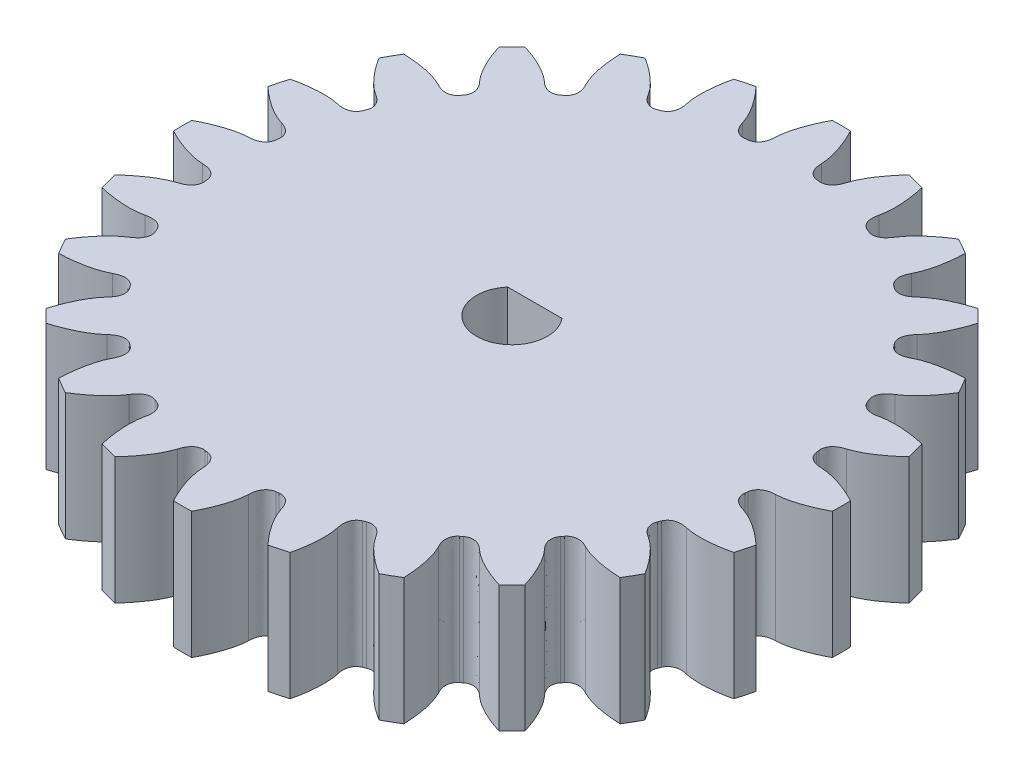
from build123d import *

# Parameters (mm, degrees)
EXTRUDE_1_DEPTH = 5


with BuildPart() as part:
    # Эскиз1 → Бобышка-Вытянуть1 (new body)
    with BuildSketch(Plane(origin=(0, 0, 0), x_dir=(1, 0, 0), z_dir=(0, 1, 0))):
        with BuildLine():
            add(Edge.make_bspline(
                [(0.905776829, 11.30170004), (0.903153797, 11.364174343), (0.897985909, 11.426330365), (0.890273167, 11.488168106), (0.882433861, 11.551020594), (0.871236283, 11.61359405), (0.858868063, 11.675739131), (0.846302347, 11.73887655), (0.831417931, 11.801647657), (0.815287884, 11.863979043), (0.798904868, 11.927287976), (0.780635548, 11.990183506), (0.761176822, 12.052620709), (0.741417879, 12.116021219), (0.720022631, 12.178974672), (0.697502256, 12.241450826), (0.67463984, 12.304875873), (0.650308122, 12.367826515), (0.624909495, 12.430281414), (0.599130965, 12.493670489), (0.572004587, 12.556561325), (0.543862193, 12.618938569), (0.515305116, 12.682234954), (0.485493692, 12.745011445), (0.45471074, 12.807257013), (0.423480821, 12.870406383), (0.391153926, 12.933013083), (0.357730054, 12.995077114)],
                knots=[0, 0, 0, 0, 1, 1, 1, 2, 2, 2, 3, 3, 3, 4, 4, 4, 5, 5, 5, 6, 6, 6, 7, 7, 7, 8, 8, 8, 9, 9, 9, 9], degree=3))
            ThreePointArc((0.357730054, 12.995077114), (0, 13), (-0.357730054, 12.995077114))
            add(Edge.make_bspline(
                [(-0.905776829, 11.30170004), (-0.903153797, 11.364174343), (-0.897985909, 11.426330365), (-0.890273167, 11.488168106), (-0.882433861, 11.551020594), (-0.871236283, 11.61359405), (-0.858868063, 11.675739131), (-0.846302347, 11.73887655), (-0.831417931, 11.801647657), (-0.815287884, 11.863979043), (-0.798904868, 11.927287976), (-0.780635548, 11.990183506), (-0.761176822, 12.052620709), (-0.741417879, 12.116021219), (-0.720022631, 12.178974672), (-0.697502256, 12.241450826), (-0.67463984, 12.304875873), (-0.650308122, 12.367826515), (-0.624909495, 12.430281414), (-0.599130965, 12.493670489), (-0.572004587, 12.556561325), (-0.543862193, 12.618938569), (-0.515305116, 12.682234954), (-0.485493692, 12.745011445), (-0.45471074, 12.807257013), (-0.423480821, 12.870406383), (-0.391153926, 12.933013083), (-0.357730054, 12.995077114)],
                knots=[0, 0, 0, 0, 1, 1, 1, 2, 2, 2, 3, 3, 3, 4, 4, 4, 5, 5, 5, 6, 6, 6, 7, 7, 7, 8, 8, 8, 9, 9, 9, 9], degree=3))
            add(Edge.make_bspline(
                [(-0.905776829, 11.30170004), (-0.905771657, 11.23039326), (-0.913828063, 11.160800255), (-0.929946047, 11.092921025), (-0.939606651, 11.052236386), (-0.951337627, 11.011263415), (-0.96761603, 10.972714088), (-0.979860318, 10.943718059), (-0.994015249, 10.915028809), (-1.010665897, 10.888305341), (-1.024787349, 10.865641106), (-1.040586182, 10.843617085), (-1.057994763, 10.823361181), (-1.073764387, 10.8050123), (-1.090989796, 10.787535026), (-1.10932187, 10.771741608), (-1.126572142, 10.756880182), (-1.145069758, 10.743071473), (-1.164321541, 10.730911074), (-1.182867326, 10.719196619), (-1.202457761, 10.708685073), (-1.222516171, 10.6998039), (-1.242144834, 10.691113003), (-1.262615206, 10.683752451), (-1.283298802, 10.67800565), (-1.303777222, 10.672315856), (-1.324670017, 10.668115352), (-1.345977185, 10.665404138)],
                knots=[0, 0, 0, 0, 1, 1, 1, 2, 2, 2, 3, 3, 3, 4, 4, 4, 5, 5, 5, 6, 6, 6, 7, 7, 7, 8, 8, 8, 9, 9, 9, 9], degree=3))
            ThreePointArc((-1.345977185, 10.665404138), (-1.403156566, 10.65803226), (-1.46029559, 10.650353834))
            add(Edge.make_bspline(
                [(-2.05018198, 11.151036243), (-2.031731423, 11.082157845), (-2.005937537, 11.017021315), (-1.972800323, 10.955626655), (-1.952938937, 10.91882866), (-1.931003099, 10.882288009), (-1.905302069, 10.849265379), (-1.88597027, 10.824426421), (-1.864872333, 10.800378299), (-1.8418725, 10.778874916), (-1.822366288, 10.760637847), (-1.801405552, 10.743453315), (-1.77934754, 10.728393287), (-1.759366213, 10.714751107), (-1.738204295, 10.702327621), (-1.716409234, 10.69181704), (-1.69590033, 10.681926704), (-1.674459048, 10.673376051), (-1.652715911, 10.666612735), (-1.631770134, 10.660097443), (-1.610126638, 10.655014447), (-1.588453086, 10.651627391), (-1.567243883, 10.648312902), (-1.545565971, 10.646501276), (-1.52409977, 10.646303601), (-1.502846508, 10.646107887), (-1.481578448, 10.647457965), (-1.46029559, 10.650353834)],
                knots=[0, 0, 0, 0, 1, 1, 1, 2, 2, 2, 3, 3, 3, 4, 4, 4, 5, 5, 5, 6, 6, 6, 7, 7, 7, 8, 8, 8, 9, 9, 9, 9], degree=3))
            add(Edge.make_bspline(
                [(-2.05018198, 11.151036243), (-2.068885174, 11.210702895), (-2.089964133, 11.269403455), (-2.113418854, 11.327137921), (-2.137258464, 11.385819801), (-2.164269696, 11.443362972), (-2.192300809, 11.50018938), (-2.220779525, 11.557923196), (-2.251403125, 11.614703059), (-2.283116104, 11.670735792), (-2.31532644, 11.727647289), (-2.349251809, 11.783671257), (-2.384207432, 11.838944675), (-2.419702365, 11.895070875), (-2.45666214, 11.950341743), (-2.494585171, 12.004860372), (-2.533084179, 12.060207035), (-2.572879639, 12.114715173), (-2.613577346, 12.168468325), (-2.654883793, 12.223025495), (-2.697363208, 12.276752555), (-2.740691092, 12.329720558), (-2.784657421, 12.383469055), (-2.829700796, 12.436390725), (-2.875545183, 12.488548112), (-2.922055228, 12.541462822), (-2.969484417, 12.593569434), (-3.017832751, 12.64486795)],
                knots=[0, 0, 0, 0, 1, 1, 1, 2, 2, 2, 3, 3, 3, 4, 4, 4, 5, 5, 5, 6, 6, 6, 7, 7, 7, 8, 8, 8, 9, 9, 9, 9], degree=3))
            ThreePointArc((-3.017832751, 12.64486795), (-3.364647586, 12.557035742), (-3.708914148, 12.459693248))
            add(Edge.make_bspline(
                [(-3.800008445, 10.682171655), (-3.813644329, 10.743196089), (-3.824739696, 10.804571744), (-3.833294544, 10.866298619), (-3.841989776, 10.929038422), (-3.847368949, 10.992377886), (-3.851506497, 11.055606556), (-3.855710113, 11.119844866), (-3.857579229, 11.184329469), (-3.85813135, 11.248711729), (-3.85869213, 11.314103698), (-3.857323882, 11.379584563), (-3.854688134, 11.444930559), (-3.85201172, 11.51128474), (-3.847639049, 11.577630603), (-3.842056056, 11.643806636), (-3.836388268, 11.710987756), (-3.829178458, 11.778090919), (-3.820809786, 11.844991368), (-3.812315939, 11.912892486), (-3.802391216, 11.980661192), (-3.791352169, 12.048196771), (-3.78015046, 12.116727499), (-3.767602588, 12.185080697), (-3.753978878, 12.253172513), (-3.740157352, 12.322253018), (-3.725135776, 12.391093263), (-3.708914148, 12.459693248)],
                knots=[0, 0, 0, 0, 1, 1, 1, 2, 2, 2, 3, 3, 3, 4, 4, 4, 5, 5, 5, 6, 6, 6, 7, 7, 7, 8, 8, 8, 9, 9, 9, 9], degree=3))
            add(Edge.make_bspline(
                [(-3.800008445, 10.682171655), (-3.781547896, 10.613295934), (-3.771317792, 10.543989102), (-3.769318131, 10.474251159), (-3.768119598, 10.432452467), (-3.768846266, 10.389839417), (-3.774592696, 10.348390465), (-3.778915046, 10.317213397), (-3.785162334, 10.285838144), (-3.794329082, 10.255715751), (-3.802103423, 10.23016888), (-3.811663687, 10.204806271), (-3.823236471, 10.180734898), (-3.833719719, 10.158929761), (-3.845834734, 10.137589747), (-3.859454521, 10.117589786), (-3.872270584, 10.098770052), (-3.886563952, 10.080644328), (-3.902012404, 10.063915557), (-3.916894333, 10.047800259), (-3.933096651, 10.032576508), (-3.95017297, 10.018806455), (-3.966883434, 10.005331422), (-3.984751244, 9.992923552), (-4.003242682, 9.98201926), (-4.02155069, 9.971223136), (-4.040644409, 9.961758307), (-4.060523839, 9.953624775)],
                knots=[0, 0, 0, 0, 1, 1, 1, 2, 2, 2, 3, 3, 3, 4, 4, 4, 5, 5, 5, 6, 6, 6, 7, 7, 7, 8, 8, 8, 9, 9, 9, 9], degree=3))
            ThreePointArc((-4.060523839, 9.953624775), (-4.113846898, 9.931704974), (-4.167051634, 9.909499517))
            add(Edge.make_bspline(
                [(-4.866424275, 10.240447755), (-4.830775365, 10.178691686), (-4.78900181, 10.122450579), (-4.741103611, 10.071724433), (-4.712394964, 10.041320804), (-4.681749155, 10.011702659), (-4.648376981, 9.986457164), (-4.623275101, 9.96746801), (-4.596671947, 9.949699856), (-4.568890329, 9.934881978), (-4.545328675, 9.922314901), (-4.520634474, 9.911140955), (-4.495430249, 9.902303119), (-4.472598913, 9.894297334), (-4.448942635, 9.887774275), (-4.425169884, 9.883262811), (-4.402799996, 9.879017574), (-4.379876237, 9.876307689), (-4.357123505, 9.875402366), (-4.335205155, 9.874530243), (-4.312983568, 9.875222195), (-4.29117189, 9.877560078), (-4.26982752, 9.879847873), (-4.248419382, 9.883708634), (-4.227633462, 9.889073556), (-4.207053733, 9.89438526), (-4.18685979, 9.901193914), (-4.167051634, 9.909499517)],
                knots=[0, 0, 0, 0, 1, 1, 1, 2, 2, 2, 3, 3, 3, 4, 4, 4, 5, 5, 5, 6, 6, 6, 7, 7, 7, 8, 8, 8, 9, 9, 9, 9], degree=3))
            add(Edge.make_bspline(
                [(-4.866424275, 10.240447755), (-4.89993304, 10.293240572), (-4.935486573, 10.344485323), (-4.973084874, 10.394182006), (-5.011300156, 10.444694204), (-5.052284271, 10.493285618), (-5.094068004, 10.540920727), (-5.136518943, 10.589316478), (-5.180794779, 10.636235643), (-5.225929503, 10.682151183), (-5.271772077, 10.72878682), (-5.319041538, 10.774121286), (-5.36711189, 10.818464127), (-5.415923891, 10.863491108), (-5.465929446, 10.907312773), (-5.51667074, 10.950158522), (-5.568182697, 10.993655017), (-5.620729904, 11.036006012), (-5.67395321, 11.077394228), (-5.727972608, 11.119401513), (-5.782910159, 11.160303386), (-5.838470809, 11.200252466), (-5.894850156, 11.240790204), (-5.952055852, 11.280250529), (-6.009837454, 11.318765296), (-6.068458042, 11.357839295), (-6.127757305, 11.39589484), (-6.187735242, 11.432931932)],
                knots=[0, 0, 0, 0, 1, 1, 1, 2, 2, 2, 3, 3, 3, 4, 4, 4, 5, 5, 5, 6, 6, 6, 7, 7, 7, 8, 8, 8, 9, 9, 9, 9], degree=3))
            ThreePointArc((-6.187735242, 11.432931932), (-6.5, 11.258330249), (-6.807341872, 11.075201878))
            add(Edge.make_bspline(
                [(-6.435275764, 9.334670926), (-6.464241303, 9.390086775), (-6.490843792, 9.446499413), (-6.515083232, 9.503908839), (-6.539720437, 9.562260343), (-6.561309779, 9.622049335), (-6.581671127, 9.682052664), (-6.602357607, 9.743014131), (-6.620852878, 9.804817712), (-6.63804954, 9.866863299), (-6.655515899, 9.929881951), (-6.671141968, 9.993485738), (-6.685508819, 10.057287305), (-6.700097328, 10.122073229), (-6.713045225, 10.187290142), (-6.724780086, 10.252656266), (-6.736693176, 10.319015177), (-6.747096611, 10.385697891), (-6.756328205, 10.452484734), (-6.765697881, 10.520270548), (-6.773651166, 10.588298798), (-6.78046776, 10.656390273), (-6.787384798, 10.725485089), (-6.792955594, 10.794756837), (-6.797419559, 10.864054556), (-6.801948341, 10.934358474), (-6.805255778, 11.004740914), (-6.807341872, 11.075201878)],
                knots=[0, 0, 0, 0, 1, 1, 1, 2, 2, 2, 3, 3, 3, 4, 4, 4, 5, 5, 5, 6, 6, 6, 7, 7, 7, 8, 8, 8, 9, 9, 9, 9], degree=3))
            add(Edge.make_bspline(
                [(-6.435275764, 9.334670926), (-6.399617895, 9.272920029), (-6.371798445, 9.208622516), (-6.351817413, 9.141778386), (-6.339841422, 9.101714154), (-6.32951426, 9.060365032), (-6.324337108, 9.018841134), (-6.320442957, 8.987607692), (-6.318356862, 8.955684607), (-6.319415012, 8.924216081), (-6.320312431, 8.897527551), (-6.322982611, 8.870554774), (-6.327930932, 8.844308356), (-6.332413387, 8.820532946), (-6.338592391, 8.796784479), (-6.346571724, 8.773940941), (-6.354080185, 8.752445432), (-6.363195236, 8.731237931), (-6.373787569, 8.711080826), (-6.383991463, 8.691662917), (-6.395701505, 8.672764433), (-6.40863201, 8.655043907), (-6.421285484, 8.637703038), (-6.435333069, 8.621093427), (-6.450372188, 8.605774754), (-6.465262123, 8.590608037), (-6.481255562, 8.576523897), (-6.498352504, 8.563522332)],
                knots=[0, 0, 0, 0, 1, 1, 1, 2, 2, 2, 3, 3, 3, 4, 4, 4, 5, 5, 5, 6, 6, 6, 7, 7, 7, 8, 8, 8, 9, 9, 9, 9], degree=3))
            ThreePointArc((-6.498352504, 8.563522332), (-6.544185362, 8.528548408), (-6.589829995, 8.493329185))
            add(Edge.make_bspline(
                [(-7.351027799, 8.631989675), (-7.300609948, 8.581564511), (-7.245703523, 8.538051564), (-7.186308524, 8.501450836), (-7.150709061, 8.47951353), (-7.113441743, 8.458836318), (-7.074672683, 8.443088397), (-7.045511375, 8.431243127), (-7.015215964, 8.420965811), (-6.984545833, 8.413843251), (-6.958534424, 8.407802592), (-6.931789628, 8.403400719), (-6.905156815, 8.401387358), (-6.881031389, 8.399563548), (-6.856492887, 8.399385452), (-6.83236252, 8.401180553), (-6.80965612, 8.402869722), (-6.786812099, 8.40618528), (-6.764600332, 8.411199646), (-6.74320311, 8.416030126), (-6.721917795, 8.42244987), (-6.701454421, 8.430353369), (-6.681429467, 8.438087539), (-6.661750033, 8.447357581), (-6.64306092, 8.45791949), (-6.624557198, 8.468376628), (-6.606813556, 8.480179859), (-6.589829995, 8.493329185)],
                knots=[0, 0, 0, 0, 1, 1, 1, 2, 2, 2, 3, 3, 3, 4, 4, 4, 5, 5, 5, 6, 6, 6, 7, 7, 7, 8, 8, 8, 9, 9, 9, 9], degree=3))
            add(Edge.make_bspline(
                [(-7.351027799, 8.631989675), (-7.397058566, 8.674310914), (-7.444663759, 8.714607611), (-7.493843377, 8.752879765), (-7.543830025, 8.791779958), (-7.595994023, 8.828108191), (-7.648682883, 8.863305747), (-7.702213083, 8.89906534), (-7.75712383, 8.932926344), (-7.812604442, 8.965595625), (-7.868955159, 8.998777259), (-7.926347375, 9.030332754), (-7.984256542, 9.060723127), (-8.043059155, 9.091582375), (-8.102702693, 9.120968463), (-8.162804316, 9.149221466), (-8.223818766, 9.177903577), (-8.285536715, 9.20521128), (-8.347658539, 9.231414022), (-8.410709557, 9.258008693), (-8.474361339, 9.283297984), (-8.538368389, 9.307505679), (-8.603318594, 9.332070078), (-8.668788137, 9.355379901), (-8.734569235, 9.37762733), (-8.801305469, 9.40019779), (-8.868433658, 9.421608846), (-8.935953802, 9.441860497)],
                knots=[0, 0, 0, 0, 1, 1, 1, 2, 2, 2, 3, 3, 3, 4, 4, 4, 5, 5, 5, 6, 6, 6, 7, 7, 7, 8, 8, 8, 9, 9, 9, 9], degree=3))
            ThreePointArc((-8.935953802, 9.441860497), (-9.192388155, 9.192388155), (-9.441860497, 8.935953802))
            add(Edge.make_bspline(
                [(-8.631989675, 7.351027799), (-8.674310914, 7.397058566), (-8.714607611, 7.444663759), (-8.752879765, 7.493843377), (-8.791779958, 7.543830025), (-8.828108191, 7.595994023), (-8.863305747, 7.648682883), (-8.89906534, 7.702213083), (-8.932926344, 7.75712383), (-8.965595625, 7.812604442), (-8.998777259, 7.868955159), (-9.030332754, 7.926347375), (-9.060723127, 7.984256542), (-9.091582375, 8.043059155), (-9.120968463, 8.102702693), (-9.149221466, 8.162804316), (-9.177903577, 8.223818766), (-9.20521128, 8.285536715), (-9.231414022, 8.347658539), (-9.258008693, 8.410709557), (-9.283297984, 8.474361339), (-9.307505679, 8.538368389), (-9.332070078, 8.603318594), (-9.355379901, 8.668788137), (-9.37762733, 8.734569235), (-9.40019779, 8.801305469), (-9.421608846, 8.868433658), (-9.441860497, 8.935953802)],
                knots=[0, 0, 0, 0, 1, 1, 1, 2, 2, 2, 3, 3, 3, 4, 4, 4, 5, 5, 5, 6, 6, 6, 7, 7, 7, 8, 8, 8, 9, 9, 9, 9], degree=3))
            add(Edge.make_bspline(
                [(-8.631989675, 7.351027799), (-8.581564511, 7.300609948), (-8.538051564, 7.245703523), (-8.501450836, 7.186308524), (-8.47951353, 7.150709061), (-8.458836318, 7.113441743), (-8.443088397, 7.074672683), (-8.431243127, 7.045511375), (-8.420965811, 7.015215964), (-8.413843251, 6.984545833), (-8.407802592, 6.958534424), (-8.403400719, 6.931789628), (-8.401387358, 6.905156815), (-8.399563548, 6.881031389), (-8.399385452, 6.856492887), (-8.401180553, 6.83236252), (-8.402869722, 6.80965612), (-8.40618528, 6.786812099), (-8.411199646, 6.764600332), (-8.416030126, 6.74320311), (-8.42244987, 6.721917795), (-8.430353369, 6.701454421), (-8.438087539, 6.681429467), (-8.447357581, 6.661750033), (-8.45791949, 6.64306092), (-8.468376628, 6.624557198), (-8.480179859, 6.606813556), (-8.493329185, 6.589829995)],
                knots=[0, 0, 0, 0, 1, 1, 1, 2, 2, 2, 3, 3, 3, 4, 4, 4, 5, 5, 5, 6, 6, 6, 7, 7, 7, 8, 8, 8, 9, 9, 9, 9], degree=3))
            ThreePointArc((-8.493329185, 6.589829995), (-8.528548408, 6.544185362), (-8.563522332, 6.498352504))
            add(Edge.make_bspline(
                [(-9.334670926, 6.435275764), (-9.272920029, 6.399617895), (-9.208622516, 6.371798445), (-9.141778386, 6.351817413), (-9.101714154, 6.339841422), (-9.060365032, 6.32951426), (-9.018841134, 6.324337108), (-8.987607692, 6.320442957), (-8.955684607, 6.318356862), (-8.924216081, 6.319415012), (-8.897527551, 6.320312431), (-8.870554774, 6.322982611), (-8.844308356, 6.327930932), (-8.820532946, 6.332413387), (-8.796784479, 6.338592391), (-8.773940941, 6.346571724), (-8.752445432, 6.354080185), (-8.731237931, 6.363195236), (-8.711080826, 6.373787569), (-8.691662917, 6.383991463), (-8.672764433, 6.395701505), (-8.655043907, 6.40863201), (-8.637703038, 6.421285484), (-8.621093427, 6.435333069), (-8.605774754, 6.450372188), (-8.590608037, 6.465262123), (-8.576523897, 6.481255562), (-8.563522332, 6.498352504)],
                knots=[0, 0, 0, 0, 1, 1, 1, 2, 2, 2, 3, 3, 3, 4, 4, 4, 5, 5, 5, 6, 6, 6, 7, 7, 7, 8, 8, 8, 9, 9, 9, 9], degree=3))
            add(Edge.make_bspline(
                [(-9.334670926, 6.435275764), (-9.390086775, 6.464241303), (-9.446499413, 6.490843792), (-9.503908839, 6.515083232), (-9.562260343, 6.539720437), (-9.622049335, 6.561309779), (-9.682052664, 6.581671127), (-9.743014131, 6.602357607), (-9.804817712, 6.620852878), (-9.866863299, 6.63804954), (-9.929881951, 6.655515899), (-9.993485738, 6.671141968), (-10.057287305, 6.685508819), (-10.122073229, 6.700097328), (-10.187290142, 6.713045225), (-10.252656266, 6.724780086), (-10.319015177, 6.736693176), (-10.385697891, 6.747096611), (-10.452484734, 6.756328205), (-10.520270548, 6.765697881), (-10.588298798, 6.773651166), (-10.656390273, 6.78046776), (-10.725485089, 6.787384798), (-10.794756837, 6.792955594), (-10.864054556, 6.797419559), (-10.934358474, 6.801948341), (-11.004740914, 6.805255778), (-11.075201878, 6.807341872)],
                knots=[0, 0, 0, 0, 1, 1, 1, 2, 2, 2, 3, 3, 3, 4, 4, 4, 5, 5, 5, 6, 6, 6, 7, 7, 7, 8, 8, 8, 9, 9, 9, 9], degree=3))
            ThreePointArc((-11.075201878, 6.807341872), (-11.258330249, 6.5), (-11.432931932, 6.187735242))
            add(Edge.make_bspline(
                [(-10.240447755, 4.866424275), (-10.293240572, 4.89993304), (-10.344485323, 4.935486573), (-10.394182006, 4.973084874), (-10.444694204, 5.011300156), (-10.493285618, 5.052284271), (-10.540920727, 5.094068004), (-10.589316478, 5.136518943), (-10.636235643, 5.180794779), (-10.682151183, 5.225929503), (-10.72878682, 5.271772077), (-10.774121286, 5.319041538), (-10.818464127, 5.36711189), (-10.863491108, 5.415923891), (-10.907312773, 5.465929446), (-10.950158522, 5.51667074), (-10.993655017, 5.568182697), (-11.036006012, 5.620729904), (-11.077394228, 5.67395321), (-11.119401513, 5.727972608), (-11.160303386, 5.782910159), (-11.200252466, 5.838470809), (-11.240790204, 5.894850156), (-11.280250529, 5.952055852), (-11.318765296, 6.009837454), (-11.357839295, 6.068458042), (-11.39589484, 6.127757305), (-11.432931932, 6.187735242)],
                knots=[0, 0, 0, 0, 1, 1, 1, 2, 2, 2, 3, 3, 3, 4, 4, 4, 5, 5, 5, 6, 6, 6, 7, 7, 7, 8, 8, 8, 9, 9, 9, 9], degree=3))
            add(Edge.make_bspline(
                [(-10.240447755, 4.866424275), (-10.178691686, 4.830775365), (-10.122450579, 4.78900181), (-10.071724433, 4.741103611), (-10.041320804, 4.712394964), (-10.011702659, 4.681749155), (-9.986457164, 4.648376981), (-9.96746801, 4.623275101), (-9.949699856, 4.596671947), (-9.934881978, 4.568890329), (-9.922314901, 4.545328675), (-9.911140955, 4.520634474), (-9.902303119, 4.495430249), (-9.894297334, 4.472598913), (-9.887774275, 4.448942635), (-9.883262811, 4.425169884), (-9.879017574, 4.402799996), (-9.876307689, 4.379876237), (-9.875402366, 4.357123505), (-9.874530243, 4.335205155), (-9.875222195, 4.312983568), (-9.877560078, 4.29117189), (-9.879847873, 4.26982752), (-9.883708634, 4.248419382), (-9.889073556, 4.227633462), (-9.89438526, 4.207053733), (-9.901193914, 4.18685979), (-9.909499517, 4.167051634)],
                knots=[0, 0, 0, 0, 1, 1, 1, 2, 2, 2, 3, 3, 3, 4, 4, 4, 5, 5, 5, 6, 6, 6, 7, 7, 7, 8, 8, 8, 9, 9, 9, 9], degree=3))
            ThreePointArc((-9.909499517, 4.167051634), (-9.931704974, 4.113846898), (-9.953624775, 4.060523839))
            add(Edge.make_bspline(
                [(-10.682171655, 3.800008445), (-10.613295934, 3.781547896), (-10.543989102, 3.771317792), (-10.474251159, 3.769318131), (-10.432452467, 3.768119598), (-10.389839417, 3.768846266), (-10.348390465, 3.774592696), (-10.317213397, 3.778915046), (-10.285838144, 3.785162334), (-10.255715751, 3.794329082), (-10.23016888, 3.802103423), (-10.204806271, 3.811663687), (-10.180734898, 3.823236471), (-10.158929761, 3.833719719), (-10.137589747, 3.845834734), (-10.117589786, 3.859454521), (-10.098770052, 3.872270584), (-10.080644328, 3.886563952), (-10.063915557, 3.902012404), (-10.047800259, 3.916894333), (-10.032576508, 3.933096651), (-10.018806455, 3.95017297), (-10.005331422, 3.966883434), (-9.992923552, 3.984751244), (-9.98201926, 4.003242682), (-9.971223136, 4.02155069), (-9.961758307, 4.040644409), (-9.953624775, 4.060523839)],
                knots=[0, 0, 0, 0, 1, 1, 1, 2, 2, 2, 3, 3, 3, 4, 4, 4, 5, 5, 5, 6, 6, 6, 7, 7, 7, 8, 8, 8, 9, 9, 9, 9], degree=3))
            add(Edge.make_bspline(
                [(-10.682171655, 3.800008445), (-10.743196089, 3.813644329), (-10.804571744, 3.824739696), (-10.866298619, 3.833294544), (-10.929038422, 3.841989776), (-10.992377886, 3.847368949), (-11.055606556, 3.851506497), (-11.119844866, 3.855710113), (-11.184329469, 3.857579229), (-11.248711729, 3.85813135), (-11.314103698, 3.85869213), (-11.379584563, 3.857323882), (-11.444930559, 3.854688134), (-11.51128474, 3.85201172), (-11.577630603, 3.847639049), (-11.643806636, 3.842056056), (-11.710987756, 3.836388268), (-11.778090919, 3.829178458), (-11.844991368, 3.820809786), (-11.912892486, 3.812315939), (-11.980661192, 3.802391216), (-12.048196771, 3.791352169), (-12.116727499, 3.78015046), (-12.185080697, 3.767602588), (-12.253172513, 3.753978878), (-12.322253018, 3.740157352), (-12.391093263, 3.725135776), (-12.459693248, 3.708914148)],
                knots=[0, 0, 0, 0, 1, 1, 1, 2, 2, 2, 3, 3, 3, 4, 4, 4, 5, 5, 5, 6, 6, 6, 7, 7, 7, 8, 8, 8, 9, 9, 9, 9], degree=3))
            ThreePointArc((-12.459693248, 3.708914148), (-12.557035742, 3.364647586), (-12.64486795, 3.017832751))
            add(Edge.make_bspline(
                [(-11.151036243, 2.05018198), (-11.210702895, 2.068885174), (-11.269403455, 2.089964133), (-11.327137921, 2.113418854), (-11.385819801, 2.137258464), (-11.443362972, 2.164269696), (-11.50018938, 2.192300809), (-11.557923196, 2.220779525), (-11.614703059, 2.251403125), (-11.670735792, 2.283116104), (-11.727647289, 2.31532644), (-11.783671257, 2.349251809), (-11.838944675, 2.384207432), (-11.895070875, 2.419702365), (-11.950341743, 2.45666214), (-12.004860372, 2.494585171), (-12.060207035, 2.533084179), (-12.114715173, 2.572879639), (-12.168468325, 2.613577346), (-12.223025495, 2.654883793), (-12.276752555, 2.697363208), (-12.329720558, 2.740691092), (-12.383469055, 2.784657421), (-12.436390725, 2.829700796), (-12.488548112, 2.875545183), (-12.541462822, 2.922055228), (-12.593569434, 2.969484417), (-12.64486795, 3.017832751)],
                knots=[0, 0, 0, 0, 1, 1, 1, 2, 2, 2, 3, 3, 3, 4, 4, 4, 5, 5, 5, 6, 6, 6, 7, 7, 7, 8, 8, 8, 9, 9, 9, 9], degree=3))
            add(Edge.make_bspline(
                [(-11.151036243, 2.05018198), (-11.082157845, 2.031731423), (-11.017021315, 2.005937537), (-10.955626655, 1.972800323), (-10.91882866, 1.952938937), (-10.882288009, 1.931003099), (-10.849265379, 1.905302069), (-10.824426421, 1.88597027), (-10.800378299, 1.864872333), (-10.778874916, 1.8418725), (-10.760637847, 1.822366288), (-10.743453315, 1.801405552), (-10.728393287, 1.77934754), (-10.714751107, 1.759366213), (-10.702327621, 1.738204295), (-10.69181704, 1.716409234), (-10.681926704, 1.69590033), (-10.673376051, 1.674459048), (-10.666612735, 1.652715911), (-10.660097443, 1.631770134), (-10.655014447, 1.610126638), (-10.651627391, 1.588453086), (-10.648312902, 1.567243883), (-10.646501276, 1.545565971), (-10.646303601, 1.52409977), (-10.646107887, 1.502846508), (-10.647457965, 1.481578448), (-10.650353834, 1.46029559)],
                knots=[0, 0, 0, 0, 1, 1, 1, 2, 2, 2, 3, 3, 3, 4, 4, 4, 5, 5, 5, 6, 6, 6, 7, 7, 7, 8, 8, 8, 9, 9, 9, 9], degree=3))
            ThreePointArc((-10.650353834, 1.46029559), (-10.65803226, 1.403156566), (-10.665404138, 1.345977185))
            add(Edge.make_bspline(
                [(-11.30170004, 0.905776829), (-11.23039326, 0.905771657), (-11.160800255, 0.913828063), (-11.092921025, 0.929946047), (-11.052236386, 0.939606651), (-11.011263415, 0.951337627), (-10.972714088, 0.96761603), (-10.943718059, 0.979860318), (-10.915028809, 0.994015249), (-10.888305341, 1.010665897), (-10.865641106, 1.024787349), (-10.843617085, 1.040586182), (-10.823361181, 1.057994763), (-10.8050123, 1.073764387), (-10.787535026, 1.090989796), (-10.771741608, 1.10932187), (-10.756880182, 1.126572142), (-10.743071473, 1.145069758), (-10.730911074, 1.164321541), (-10.719196619, 1.182867326), (-10.708685073, 1.202457761), (-10.6998039, 1.222516171), (-10.691113003, 1.242144834), (-10.683752451, 1.262615206), (-10.67800565, 1.283298802), (-10.672315856, 1.303777222), (-10.668115352, 1.324670017), (-10.665404138, 1.345977185)],
                knots=[0, 0, 0, 0, 1, 1, 1, 2, 2, 2, 3, 3, 3, 4, 4, 4, 5, 5, 5, 6, 6, 6, 7, 7, 7, 8, 8, 8, 9, 9, 9, 9], degree=3))
            add(Edge.make_bspline(
                [(-11.30170004, 0.905776829), (-11.364174343, 0.903153797), (-11.426330365, 0.897985909), (-11.488168106, 0.890273167), (-11.551020594, 0.882433861), (-11.61359405, 0.871236283), (-11.675739131, 0.858868063), (-11.73887655, 0.846302347), (-11.801647657, 0.831417931), (-11.863979043, 0.815287884), (-11.927287976, 0.798904868), (-11.990183506, 0.780635548), (-12.052620709, 0.761176822), (-12.116021219, 0.741417879), (-12.178974672, 0.720022631), (-12.241450826, 0.697502256), (-12.304875873, 0.67463984), (-12.367826515, 0.650308122), (-12.430281414, 0.624909495), (-12.493670489, 0.599130965), (-12.556561325, 0.572004587), (-12.618938569, 0.543862193), (-12.682234954, 0.515305116), (-12.745011445, 0.485493692), (-12.807257013, 0.45471074), (-12.870406383, 0.423480821), (-12.933013083, 0.391153926), (-12.995077114, 0.357730054)],
                knots=[0, 0, 0, 0, 1, 1, 1, 2, 2, 2, 3, 3, 3, 4, 4, 4, 5, 5, 5, 6, 6, 6, 7, 7, 7, 8, 8, 8, 9, 9, 9, 9], degree=3))
            ThreePointArc((-12.995077114, 0.357730054), (-13, 0), (-12.995077114, -0.357730054))
            add(Edge.make_bspline(
                [(-11.30170004, -0.905776829), (-11.364174343, -0.903153797), (-11.426330365, -0.897985909), (-11.488168106, -0.890273167), (-11.551020594, -0.882433861), (-11.61359405, -0.871236283), (-11.675739131, -0.858868063), (-11.73887655, -0.846302347), (-11.801647657, -0.831417931), (-11.863979043, -0.815287884), (-11.927287976, -0.798904868), (-11.990183506, -0.780635548), (-12.052620709, -0.761176822), (-12.116021219, -0.741417879), (-12.178974672, -0.720022631), (-12.241450826, -0.697502256), (-12.304875873, -0.67463984), (-12.367826515, -0.650308122), (-12.430281414, -0.624909495), (-12.493670489, -0.599130965), (-12.556561325, -0.572004587), (-12.618938569, -0.543862193), (-12.682234954, -0.515305116), (-12.745011445, -0.485493692), (-12.807257013, -0.45471074), (-12.870406383, -0.423480821), (-12.933013083, -0.391153926), (-12.995077114, -0.357730054)],
                knots=[0, 0, 0, 0, 1, 1, 1, 2, 2, 2, 3, 3, 3, 4, 4, 4, 5, 5, 5, 6, 6, 6, 7, 7, 7, 8, 8, 8, 9, 9, 9, 9], degree=3))
            add(Edge.make_bspline(
                [(-11.30170004, -0.905776829), (-11.23039326, -0.905771657), (-11.160800255, -0.913828063), (-11.092921025, -0.929946047), (-11.052236386, -0.939606651), (-11.011263415, -0.951337627), (-10.972714088, -0.96761603), (-10.943718059, -0.979860318), (-10.915028809, -0.994015249), (-10.888305341, -1.010665897), (-10.865641106, -1.024787349), (-10.843617085, -1.040586182), (-10.823361181, -1.057994763), (-10.8050123, -1.073764387), (-10.787535026, -1.090989796), (-10.771741608, -1.10932187), (-10.756880182, -1.126572142), (-10.743071473, -1.145069758), (-10.730911074, -1.164321541), (-10.719196619, -1.182867326), (-10.708685073, -1.202457761), (-10.6998039, -1.222516171), (-10.691113003, -1.242144834), (-10.683752451, -1.262615206), (-10.67800565, -1.283298802), (-10.672315856, -1.303777222), (-10.668115352, -1.324670017), (-10.665404138, -1.345977185)],
                knots=[0, 0, 0, 0, 1, 1, 1, 2, 2, 2, 3, 3, 3, 4, 4, 4, 5, 5, 5, 6, 6, 6, 7, 7, 7, 8, 8, 8, 9, 9, 9, 9], degree=3))
            ThreePointArc((-10.665404138, -1.345977185), (-10.65803226, -1.403156566), (-10.650353834, -1.46029559))
            add(Edge.make_bspline(
                [(-11.151036243, -2.05018198), (-11.082157845, -2.031731423), (-11.017021315, -2.005937537), (-10.955626655, -1.972800323), (-10.91882866, -1.952938937), (-10.882288009, -1.931003099), (-10.849265379, -1.905302069), (-10.824426421, -1.88597027), (-10.800378299, -1.864872333), (-10.778874916, -1.8418725), (-10.760637847, -1.822366288), (-10.743453315, -1.801405552), (-10.728393287, -1.77934754), (-10.714751107, -1.759366213), (-10.702327621, -1.738204295), (-10.69181704, -1.716409234), (-10.681926704, -1.69590033), (-10.673376051, -1.674459048), (-10.666612735, -1.652715911), (-10.660097443, -1.631770134), (-10.655014447, -1.610126638), (-10.651627391, -1.588453086), (-10.648312902, -1.567243883), (-10.646501276, -1.545565971), (-10.646303601, -1.52409977), (-10.646107887, -1.502846508), (-10.647457965, -1.481578448), (-10.650353834, -1.46029559)],
                knots=[0, 0, 0, 0, 1, 1, 1, 2, 2, 2, 3, 3, 3, 4, 4, 4, 5, 5, 5, 6, 6, 6, 7, 7, 7, 8, 8, 8, 9, 9, 9, 9], degree=3))
            add(Edge.make_bspline(
                [(-11.151036243, -2.05018198), (-11.210702895, -2.068885174), (-11.269403455, -2.089964133), (-11.327137921, -2.113418854), (-11.385819801, -2.137258464), (-11.443362972, -2.164269696), (-11.50018938, -2.192300809), (-11.557923196, -2.220779525), (-11.614703059, -2.251403125), (-11.670735792, -2.283116104), (-11.727647289, -2.31532644), (-11.783671257, -2.349251809), (-11.838944675, -2.384207432), (-11.895070875, -2.419702365), (-11.950341743, -2.45666214), (-12.004860372, -2.494585171), (-12.060207035, -2.533084179), (-12.114715173, -2.572879639), (-12.168468325, -2.613577346), (-12.223025495, -2.654883793), (-12.276752555, -2.697363208), (-12.329720558, -2.740691092), (-12.383469055, -2.784657421), (-12.436390725, -2.829700796), (-12.488548112, -2.875545183), (-12.541462822, -2.922055228), (-12.593569434, -2.969484417), (-12.64486795, -3.017832751)],
                knots=[0, 0, 0, 0, 1, 1, 1, 2, 2, 2, 3, 3, 3, 4, 4, 4, 5, 5, 5, 6, 6, 6, 7, 7, 7, 8, 8, 8, 9, 9, 9, 9], degree=3))
            ThreePointArc((-12.64486795, -3.017832751), (-12.557035742, -3.364647586), (-12.459693248, -3.708914148))
            add(Edge.make_bspline(
                [(-10.682171655, -3.800008445), (-10.743196089, -3.813644329), (-10.804571744, -3.824739696), (-10.866298619, -3.833294544), (-10.929038422, -3.841989776), (-10.992377886, -3.847368949), (-11.055606556, -3.851506497), (-11.119844866, -3.855710113), (-11.184329469, -3.857579229), (-11.248711729, -3.85813135), (-11.314103698, -3.85869213), (-11.379584563, -3.857323882), (-11.444930559, -3.854688134), (-11.51128474, -3.85201172), (-11.577630603, -3.847639049), (-11.643806636, -3.842056056), (-11.710987756, -3.836388268), (-11.778090919, -3.829178458), (-11.844991368, -3.820809786), (-11.912892486, -3.812315939), (-11.980661192, -3.802391216), (-12.048196771, -3.791352169), (-12.116727499, -3.78015046), (-12.185080697, -3.767602588), (-12.253172513, -3.753978878), (-12.322253018, -3.740157352), (-12.391093263, -3.725135776), (-12.459693248, -3.708914148)],
                knots=[0, 0, 0, 0, 1, 1, 1, 2, 2, 2, 3, 3, 3, 4, 4, 4, 5, 5, 5, 6, 6, 6, 7, 7, 7, 8, 8, 8, 9, 9, 9, 9], degree=3))
            add(Edge.make_bspline(
                [(-10.682171655, -3.800008445), (-10.613295934, -3.781547896), (-10.543989102, -3.771317792), (-10.474251159, -3.769318131), (-10.432452467, -3.768119598), (-10.389839417, -3.768846266), (-10.348390465, -3.774592696), (-10.317213397, -3.778915046), (-10.285838144, -3.785162334), (-10.255715751, -3.794329082), (-10.23016888, -3.802103423), (-10.204806271, -3.811663687), (-10.180734898, -3.823236471), (-10.158929761, -3.833719719), (-10.137589747, -3.845834734), (-10.117589786, -3.859454521), (-10.098770052, -3.872270584), (-10.080644328, -3.886563952), (-10.063915557, -3.902012404), (-10.047800259, -3.916894333), (-10.032576508, -3.933096651), (-10.018806455, -3.95017297), (-10.005331422, -3.966883434), (-9.992923552, -3.984751244), (-9.98201926, -4.003242682), (-9.971223136, -4.02155069), (-9.961758307, -4.040644409), (-9.953624775, -4.060523839)],
                knots=[0, 0, 0, 0, 1, 1, 1, 2, 2, 2, 3, 3, 3, 4, 4, 4, 5, 5, 5, 6, 6, 6, 7, 7, 7, 8, 8, 8, 9, 9, 9, 9], degree=3))
            ThreePointArc((-9.953624775, -4.060523839), (-9.931704974, -4.113846898), (-9.909499517, -4.167051634))
            add(Edge.make_bspline(
                [(-10.240447755, -4.866424275), (-10.178691686, -4.830775365), (-10.122450579, -4.78900181), (-10.071724433, -4.741103611), (-10.041320804, -4.712394964), (-10.011702659, -4.681749155), (-9.986457164, -4.648376981), (-9.96746801, -4.623275101), (-9.949699856, -4.596671947), (-9.934881978, -4.568890329), (-9.922314901, -4.545328675), (-9.911140955, -4.520634474), (-9.902303119, -4.495430249), (-9.894297334, -4.472598913), (-9.887774275, -4.448942635), (-9.883262811, -4.425169884), (-9.879017574, -4.402799996), (-9.876307689, -4.379876237), (-9.875402366, -4.357123505), (-9.874530243, -4.335205155), (-9.875222195, -4.312983568), (-9.877560078, -4.29117189), (-9.879847873, -4.26982752), (-9.883708634, -4.248419382), (-9.889073556, -4.227633462), (-9.89438526, -4.207053733), (-9.901193914, -4.18685979), (-9.909499517, -4.167051634)],
                knots=[0, 0, 0, 0, 1, 1, 1, 2, 2, 2, 3, 3, 3, 4, 4, 4, 5, 5, 5, 6, 6, 6, 7, 7, 7, 8, 8, 8, 9, 9, 9, 9], degree=3))
            add(Edge.make_bspline(
                [(-10.240447755, -4.866424275), (-10.293240572, -4.89993304), (-10.344485323, -4.935486573), (-10.394182006, -4.973084874), (-10.444694204, -5.011300156), (-10.493285618, -5.052284271), (-10.540920727, -5.094068004), (-10.589316478, -5.136518943), (-10.636235643, -5.180794779), (-10.682151183, -5.225929503), (-10.72878682, -5.271772077), (-10.774121286, -5.319041538), (-10.818464127, -5.36711189), (-10.863491108, -5.415923891), (-10.907312773, -5.465929446), (-10.950158522, -5.51667074), (-10.993655017, -5.568182697), (-11.036006012, -5.620729904), (-11.077394228, -5.67395321), (-11.119401513, -5.727972608), (-11.160303386, -5.782910159), (-11.200252466, -5.838470809), (-11.240790204, -5.894850156), (-11.280250529, -5.952055852), (-11.318765296, -6.009837454), (-11.357839295, -6.068458042), (-11.39589484, -6.127757305), (-11.432931932, -6.187735242)],
                knots=[0, 0, 0, 0, 1, 1, 1, 2, 2, 2, 3, 3, 3, 4, 4, 4, 5, 5, 5, 6, 6, 6, 7, 7, 7, 8, 8, 8, 9, 9, 9, 9], degree=3))
            ThreePointArc((-11.432931932, -6.187735242), (-11.258330249, -6.5), (-11.075201878, -6.807341872))
            add(Edge.make_bspline(
                [(-9.334670926, -6.435275764), (-9.390086775, -6.464241303), (-9.446499413, -6.490843792), (-9.503908839, -6.515083232), (-9.562260343, -6.539720437), (-9.622049335, -6.561309779), (-9.682052664, -6.581671127), (-9.743014131, -6.602357607), (-9.804817712, -6.620852878), (-9.866863299, -6.63804954), (-9.929881951, -6.655515899), (-9.993485738, -6.671141968), (-10.057287305, -6.685508819), (-10.122073229, -6.700097328), (-10.187290142, -6.713045225), (-10.252656266, -6.724780086), (-10.319015177, -6.736693176), (-10.385697891, -6.747096611), (-10.452484734, -6.756328205), (-10.520270548, -6.765697881), (-10.588298798, -6.773651166), (-10.656390273, -6.78046776), (-10.725485089, -6.787384798), (-10.794756837, -6.792955594), (-10.864054556, -6.797419559), (-10.934358474, -6.801948341), (-11.004740914, -6.805255778), (-11.075201878, -6.807341872)],
                knots=[0, 0, 0, 0, 1, 1, 1, 2, 2, 2, 3, 3, 3, 4, 4, 4, 5, 5, 5, 6, 6, 6, 7, 7, 7, 8, 8, 8, 9, 9, 9, 9], degree=3))
            add(Edge.make_bspline(
                [(-9.334670926, -6.435275764), (-9.272920029, -6.399617895), (-9.208622516, -6.371798445), (-9.141778386, -6.351817413), (-9.101714154, -6.339841422), (-9.060365032, -6.32951426), (-9.018841134, -6.324337108), (-8.987607692, -6.320442957), (-8.955684607, -6.318356862), (-8.924216081, -6.319415012), (-8.897527551, -6.320312431), (-8.870554774, -6.322982611), (-8.844308356, -6.327930932), (-8.820532946, -6.332413387), (-8.796784479, -6.338592391), (-8.773940941, -6.346571724), (-8.752445432, -6.354080185), (-8.731237931, -6.363195236), (-8.711080826, -6.373787569), (-8.691662917, -6.383991463), (-8.672764433, -6.395701505), (-8.655043907, -6.40863201), (-8.637703038, -6.421285484), (-8.621093427, -6.435333069), (-8.605774754, -6.450372188), (-8.590608037, -6.465262123), (-8.576523897, -6.481255562), (-8.563522332, -6.498352504)],
                knots=[0, 0, 0, 0, 1, 1, 1, 2, 2, 2, 3, 3, 3, 4, 4, 4, 5, 5, 5, 6, 6, 6, 7, 7, 7, 8, 8, 8, 9, 9, 9, 9], degree=3))
            ThreePointArc((-8.563522332, -6.498352504), (-8.528548408, -6.544185362), (-8.493329185, -6.589829995))
            add(Edge.make_bspline(
                [(-8.631989675, -7.351027799), (-8.581564511, -7.300609948), (-8.538051564, -7.245703523), (-8.501450836, -7.186308524), (-8.47951353, -7.150709061), (-8.458836318, -7.113441743), (-8.443088397, -7.074672683), (-8.431243127, -7.045511375), (-8.420965811, -7.015215964), (-8.413843251, -6.984545833), (-8.407802592, -6.958534424), (-8.403400719, -6.931789628), (-8.401387358, -6.905156815), (-8.399563548, -6.881031389), (-8.399385452, -6.856492887), (-8.401180553, -6.83236252), (-8.402869722, -6.80965612), (-8.40618528, -6.786812099), (-8.411199646, -6.764600332), (-8.416030126, -6.74320311), (-8.42244987, -6.721917795), (-8.430353369, -6.701454421), (-8.438087539, -6.681429467), (-8.447357581, -6.661750033), (-8.45791949, -6.64306092), (-8.468376628, -6.624557198), (-8.480179859, -6.606813556), (-8.493329185, -6.589829995)],
                knots=[0, 0, 0, 0, 1, 1, 1, 2, 2, 2, 3, 3, 3, 4, 4, 4, 5, 5, 5, 6, 6, 6, 7, 7, 7, 8, 8, 8, 9, 9, 9, 9], degree=3))
            add(Edge.make_bspline(
                [(-8.631989675, -7.351027799), (-8.674310914, -7.397058566), (-8.714607611, -7.444663759), (-8.752879765, -7.493843377), (-8.791779958, -7.543830025), (-8.828108191, -7.595994023), (-8.863305747, -7.648682883), (-8.89906534, -7.702213083), (-8.932926344, -7.75712383), (-8.965595625, -7.812604442), (-8.998777259, -7.868955159), (-9.030332754, -7.926347375), (-9.060723127, -7.984256542), (-9.091582375, -8.043059155), (-9.120968463, -8.102702693), (-9.149221466, -8.162804316), (-9.177903577, -8.223818766), (-9.20521128, -8.285536715), (-9.231414022, -8.347658539), (-9.258008693, -8.410709557), (-9.283297984, -8.474361339), (-9.307505679, -8.538368389), (-9.332070078, -8.603318594), (-9.355379901, -8.668788137), (-9.37762733, -8.734569235), (-9.40019779, -8.801305469), (-9.421608846, -8.868433658), (-9.441860497, -8.935953802)],
                knots=[0, 0, 0, 0, 1, 1, 1, 2, 2, 2, 3, 3, 3, 4, 4, 4, 5, 5, 5, 6, 6, 6, 7, 7, 7, 8, 8, 8, 9, 9, 9, 9], degree=3))
            ThreePointArc((-9.441860497, -8.935953802), (-9.192388155, -9.192388155), (-8.935953802, -9.441860497))
            add(Edge.make_bspline(
                [(-7.351027799, -8.631989675), (-7.397058566, -8.674310914), (-7.444663759, -8.714607611), (-7.493843377, -8.752879765), (-7.543830025, -8.791779958), (-7.595994023, -8.828108191), (-7.648682883, -8.863305747), (-7.702213083, -8.89906534), (-7.75712383, -8.932926344), (-7.812604442, -8.965595625), (-7.868955159, -8.998777259), (-7.926347375, -9.030332754), (-7.984256542, -9.060723127), (-8.043059155, -9.091582375), (-8.102702693, -9.120968463), (-8.162804316, -9.149221466), (-8.223818766, -9.177903577), (-8.285536715, -9.20521128), (-8.347658539, -9.231414022), (-8.410709557, -9.258008693), (-8.474361339, -9.283297984), (-8.538368389, -9.307505679), (-8.603318594, -9.332070078), (-8.668788137, -9.355379901), (-8.734569235, -9.37762733), (-8.801305469, -9.40019779), (-8.868433658, -9.421608846), (-8.935953802, -9.441860497)],
                knots=[0, 0, 0, 0, 1, 1, 1, 2, 2, 2, 3, 3, 3, 4, 4, 4, 5, 5, 5, 6, 6, 6, 7, 7, 7, 8, 8, 8, 9, 9, 9, 9], degree=3))
            add(Edge.make_bspline(
                [(-7.351027799, -8.631989675), (-7.300609948, -8.581564511), (-7.245703523, -8.538051564), (-7.186308524, -8.501450836), (-7.150709061, -8.47951353), (-7.113441743, -8.458836318), (-7.074672683, -8.443088397), (-7.045511375, -8.431243127), (-7.015215964, -8.420965811), (-6.984545833, -8.413843251), (-6.958534424, -8.407802592), (-6.931789628, -8.403400719), (-6.905156815, -8.401387358), (-6.881031389, -8.399563548), (-6.856492887, -8.399385452), (-6.83236252, -8.401180553), (-6.80965612, -8.402869722), (-6.786812099, -8.40618528), (-6.764600332, -8.411199646), (-6.74320311, -8.416030126), (-6.721917795, -8.42244987), (-6.701454421, -8.430353369), (-6.681429467, -8.438087539), (-6.661750033, -8.447357581), (-6.64306092, -8.45791949), (-6.624557198, -8.468376628), (-6.606813556, -8.480179859), (-6.589829995, -8.493329185)],
                knots=[0, 0, 0, 0, 1, 1, 1, 2, 2, 2, 3, 3, 3, 4, 4, 4, 5, 5, 5, 6, 6, 6, 7, 7, 7, 8, 8, 8, 9, 9, 9, 9], degree=3))
            ThreePointArc((-6.589829995, -8.493329185), (-6.544185362, -8.528548408), (-6.498352504, -8.563522332))
            add(Edge.make_bspline(
                [(-6.435275764, -9.334670926), (-6.399617895, -9.272920029), (-6.371798445, -9.208622516), (-6.351817413, -9.141778386), (-6.339841422, -9.101714154), (-6.32951426, -9.060365032), (-6.324337108, -9.018841134), (-6.320442957, -8.987607692), (-6.318356862, -8.955684607), (-6.319415012, -8.924216081), (-6.320312431, -8.897527551), (-6.322982611, -8.870554774), (-6.327930932, -8.844308356), (-6.332413387, -8.820532946), (-6.338592391, -8.796784479), (-6.346571724, -8.773940941), (-6.354080185, -8.752445432), (-6.363195236, -8.731237931), (-6.373787569, -8.711080826), (-6.383991463, -8.691662917), (-6.395701505, -8.672764433), (-6.40863201, -8.655043907), (-6.421285484, -8.637703038), (-6.435333069, -8.621093427), (-6.450372188, -8.605774754), (-6.465262123, -8.590608037), (-6.481255562, -8.576523897), (-6.498352504, -8.563522332)],
                knots=[0, 0, 0, 0, 1, 1, 1, 2, 2, 2, 3, 3, 3, 4, 4, 4, 5, 5, 5, 6, 6, 6, 7, 7, 7, 8, 8, 8, 9, 9, 9, 9], degree=3))
            add(Edge.make_bspline(
                [(-6.435275764, -9.334670926), (-6.464241303, -9.390086775), (-6.490843792, -9.446499413), (-6.515083232, -9.503908839), (-6.539720437, -9.562260343), (-6.561309779, -9.622049335), (-6.581671127, -9.682052664), (-6.602357607, -9.743014131), (-6.620852878, -9.804817712), (-6.63804954, -9.866863299), (-6.655515899, -9.929881951), (-6.671141968, -9.993485738), (-6.685508819, -10.057287305), (-6.700097328, -10.122073229), (-6.713045225, -10.187290142), (-6.724780086, -10.252656266), (-6.736693176, -10.319015177), (-6.747096611, -10.385697891), (-6.756328205, -10.452484734), (-6.765697881, -10.520270548), (-6.773651166, -10.588298798), (-6.78046776, -10.656390273), (-6.787384798, -10.725485089), (-6.792955594, -10.794756837), (-6.797419559, -10.864054556), (-6.801948341, -10.934358474), (-6.805255778, -11.004740914), (-6.807341872, -11.075201878)],
                knots=[0, 0, 0, 0, 1, 1, 1, 2, 2, 2, 3, 3, 3, 4, 4, 4, 5, 5, 5, 6, 6, 6, 7, 7, 7, 8, 8, 8, 9, 9, 9, 9], degree=3))
            ThreePointArc((-6.807341872, -11.075201878), (-6.5, -11.258330249), (-6.187735242, -11.432931932))
            add(Edge.make_bspline(
                [(-4.866424275, -10.240447755), (-4.89993304, -10.293240572), (-4.935486573, -10.344485323), (-4.973084874, -10.394182006), (-5.011300156, -10.444694204), (-5.052284271, -10.493285618), (-5.094068004, -10.540920727), (-5.136518943, -10.589316478), (-5.180794779, -10.636235643), (-5.225929503, -10.682151183), (-5.271772077, -10.72878682), (-5.319041538, -10.774121286), (-5.36711189, -10.818464127), (-5.415923891, -10.863491108), (-5.465929446, -10.907312773), (-5.51667074, -10.950158522), (-5.568182697, -10.993655017), (-5.620729904, -11.036006012), (-5.67395321, -11.077394228), (-5.727972608, -11.119401513), (-5.782910159, -11.160303386), (-5.838470809, -11.200252466), (-5.894850156, -11.240790204), (-5.952055852, -11.280250529), (-6.009837454, -11.318765296), (-6.068458042, -11.357839295), (-6.127757305, -11.39589484), (-6.187735242, -11.432931932)],
                knots=[0, 0, 0, 0, 1, 1, 1, 2, 2, 2, 3, 3, 3, 4, 4, 4, 5, 5, 5, 6, 6, 6, 7, 7, 7, 8, 8, 8, 9, 9, 9, 9], degree=3))
            add(Edge.make_bspline(
                [(-4.866424275, -10.240447755), (-4.830775365, -10.178691686), (-4.78900181, -10.122450579), (-4.741103611, -10.071724433), (-4.712394964, -10.041320804), (-4.681749155, -10.011702659), (-4.648376981, -9.986457164), (-4.623275101, -9.96746801), (-4.596671947, -9.949699856), (-4.568890329, -9.934881978), (-4.545328675, -9.922314901), (-4.520634474, -9.911140955), (-4.495430249, -9.902303119), (-4.472598913, -9.894297334), (-4.448942635, -9.887774275), (-4.425169884, -9.883262811), (-4.402799996, -9.879017574), (-4.379876237, -9.876307689), (-4.357123505, -9.875402366), (-4.335205155, -9.874530243), (-4.312983568, -9.875222195), (-4.29117189, -9.877560078), (-4.26982752, -9.879847873), (-4.248419382, -9.883708634), (-4.227633462, -9.889073556), (-4.207053733, -9.89438526), (-4.18685979, -9.901193914), (-4.167051634, -9.909499517)],
                knots=[0, 0, 0, 0, 1, 1, 1, 2, 2, 2, 3, 3, 3, 4, 4, 4, 5, 5, 5, 6, 6, 6, 7, 7, 7, 8, 8, 8, 9, 9, 9, 9], degree=3))
            ThreePointArc((-4.167051634, -9.909499517), (-4.113846898, -9.931704974), (-4.060523839, -9.953624775))
            add(Edge.make_bspline(
                [(-3.800008445, -10.682171655), (-3.781547896, -10.613295934), (-3.771317792, -10.543989102), (-3.769318131, -10.474251159), (-3.768119598, -10.432452467), (-3.768846266, -10.389839417), (-3.774592696, -10.348390465), (-3.778915046, -10.317213397), (-3.785162334, -10.285838144), (-3.794329082, -10.255715751), (-3.802103423, -10.23016888), (-3.811663687, -10.204806271), (-3.823236471, -10.180734898), (-3.833719719, -10.158929761), (-3.845834734, -10.137589747), (-3.859454521, -10.117589786), (-3.872270584, -10.098770052), (-3.886563952, -10.080644328), (-3.902012404, -10.063915557), (-3.916894333, -10.047800259), (-3.933096651, -10.032576508), (-3.95017297, -10.018806455), (-3.966883434, -10.005331422), (-3.984751244, -9.992923552), (-4.003242682, -9.98201926), (-4.02155069, -9.971223136), (-4.040644409, -9.961758307), (-4.060523839, -9.953624775)],
                knots=[0, 0, 0, 0, 1, 1, 1, 2, 2, 2, 3, 3, 3, 4, 4, 4, 5, 5, 5, 6, 6, 6, 7, 7, 7, 8, 8, 8, 9, 9, 9, 9], degree=3))
            add(Edge.make_bspline(
                [(-3.800008445, -10.682171655), (-3.813644329, -10.743196089), (-3.824739696, -10.804571744), (-3.833294544, -10.866298619), (-3.841989776, -10.929038422), (-3.847368949, -10.992377886), (-3.851506497, -11.055606556), (-3.855710113, -11.119844866), (-3.857579229, -11.184329469), (-3.85813135, -11.248711729), (-3.85869213, -11.314103698), (-3.857323882, -11.379584563), (-3.854688134, -11.444930559), (-3.85201172, -11.51128474), (-3.847639049, -11.577630603), (-3.842056056, -11.643806636), (-3.836388268, -11.710987756), (-3.829178458, -11.778090919), (-3.820809786, -11.844991368), (-3.812315939, -11.912892486), (-3.802391216, -11.980661192), (-3.791352169, -12.048196771), (-3.78015046, -12.116727499), (-3.767602588, -12.185080697), (-3.753978878, -12.253172513), (-3.740157352, -12.322253018), (-3.725135776, -12.391093263), (-3.708914148, -12.459693248)],
                knots=[0, 0, 0, 0, 1, 1, 1, 2, 2, 2, 3, 3, 3, 4, 4, 4, 5, 5, 5, 6, 6, 6, 7, 7, 7, 8, 8, 8, 9, 9, 9, 9], degree=3))
            ThreePointArc((-3.708914148, -12.459693248), (-3.364647586, -12.557035742), (-3.017832751, -12.64486795))
            add(Edge.make_bspline(
                [(-2.05018198, -11.151036243), (-2.068885174, -11.210702895), (-2.089964133, -11.269403455), (-2.113418854, -11.327137921), (-2.137258464, -11.385819801), (-2.164269696, -11.443362972), (-2.192300809, -11.50018938), (-2.220779525, -11.557923196), (-2.251403125, -11.614703059), (-2.283116104, -11.670735792), (-2.31532644, -11.727647289), (-2.349251809, -11.783671257), (-2.384207432, -11.838944675), (-2.419702365, -11.895070875), (-2.45666214, -11.950341743), (-2.494585171, -12.004860372), (-2.533084179, -12.060207035), (-2.572879639, -12.114715173), (-2.613577346, -12.168468325), (-2.654883793, -12.223025495), (-2.697363208, -12.276752555), (-2.740691092, -12.329720558), (-2.784657421, -12.383469055), (-2.829700796, -12.436390725), (-2.875545183, -12.488548112), (-2.922055228, -12.541462822), (-2.969484417, -12.593569434), (-3.017832751, -12.64486795)],
                knots=[0, 0, 0, 0, 1, 1, 1, 2, 2, 2, 3, 3, 3, 4, 4, 4, 5, 5, 5, 6, 6, 6, 7, 7, 7, 8, 8, 8, 9, 9, 9, 9], degree=3))
            add(Edge.make_bspline(
                [(-2.05018198, -11.151036243), (-2.031731423, -11.082157845), (-2.005937537, -11.017021315), (-1.972800323, -10.955626655), (-1.952938937, -10.91882866), (-1.931003099, -10.882288009), (-1.905302069, -10.849265379), (-1.88597027, -10.824426421), (-1.864872333, -10.800378299), (-1.8418725, -10.778874916), (-1.822366288, -10.760637847), (-1.801405552, -10.743453315), (-1.77934754, -10.728393287), (-1.759366213, -10.714751107), (-1.738204295, -10.702327621), (-1.716409234, -10.69181704), (-1.69590033, -10.681926704), (-1.674459048, -10.673376051), (-1.652715911, -10.666612735), (-1.631770134, -10.660097443), (-1.610126638, -10.655014447), (-1.588453086, -10.651627391), (-1.567243883, -10.648312902), (-1.545565971, -10.646501276), (-1.52409977, -10.646303601), (-1.502846508, -10.646107887), (-1.481578448, -10.647457965), (-1.46029559, -10.650353834)],
                knots=[0, 0, 0, 0, 1, 1, 1, 2, 2, 2, 3, 3, 3, 4, 4, 4, 5, 5, 5, 6, 6, 6, 7, 7, 7, 8, 8, 8, 9, 9, 9, 9], degree=3))
            ThreePointArc((-1.46029559, -10.650353834), (-1.403156566, -10.65803226), (-1.345977185, -10.665404138))
            add(Edge.make_bspline(
                [(-0.905776829, -11.30170004), (-0.905771657, -11.23039326), (-0.913828063, -11.160800255), (-0.929946047, -11.092921025), (-0.939606651, -11.052236386), (-0.951337627, -11.011263415), (-0.96761603, -10.972714088), (-0.979860318, -10.943718059), (-0.994015249, -10.915028809), (-1.010665897, -10.888305341), (-1.024787349, -10.865641106), (-1.040586182, -10.843617085), (-1.057994763, -10.823361181), (-1.073764387, -10.8050123), (-1.090989796, -10.787535026), (-1.10932187, -10.771741608), (-1.126572142, -10.756880182), (-1.145069758, -10.743071473), (-1.164321541, -10.730911074), (-1.182867326, -10.719196619), (-1.202457761, -10.708685073), (-1.222516171, -10.6998039), (-1.242144834, -10.691113003), (-1.262615206, -10.683752451), (-1.283298802, -10.67800565), (-1.303777222, -10.672315856), (-1.324670017, -10.668115352), (-1.345977185, -10.665404138)],
                knots=[0, 0, 0, 0, 1, 1, 1, 2, 2, 2, 3, 3, 3, 4, 4, 4, 5, 5, 5, 6, 6, 6, 7, 7, 7, 8, 8, 8, 9, 9, 9, 9], degree=3))
            add(Edge.make_bspline(
                [(-0.905776829, -11.30170004), (-0.903153797, -11.364174343), (-0.897985909, -11.426330365), (-0.890273167, -11.488168106), (-0.882433861, -11.551020594), (-0.871236283, -11.61359405), (-0.858868063, -11.675739131), (-0.846302347, -11.73887655), (-0.831417931, -11.801647657), (-0.815287884, -11.863979043), (-0.798904868, -11.927287976), (-0.780635548, -11.990183506), (-0.761176822, -12.052620709), (-0.741417879, -12.116021219), (-0.720022631, -12.178974672), (-0.697502256, -12.241450826), (-0.67463984, -12.304875873), (-0.650308122, -12.367826515), (-0.624909495, -12.430281414), (-0.599130965, -12.493670489), (-0.572004587, -12.556561325), (-0.543862193, -12.618938569), (-0.515305116, -12.682234954), (-0.485493692, -12.745011445), (-0.45471074, -12.807257013), (-0.423480821, -12.870406383), (-0.391153926, -12.933013083), (-0.357730054, -12.995077114)],
                knots=[0, 0, 0, 0, 1, 1, 1, 2, 2, 2, 3, 3, 3, 4, 4, 4, 5, 5, 5, 6, 6, 6, 7, 7, 7, 8, 8, 8, 9, 9, 9, 9], degree=3))
            ThreePointArc((-0.357730054, -12.995077114), (0, -13), (0.357730054, -12.995077114))
            add(Edge.make_bspline(
                [(0.905776829, -11.30170004), (0.903153797, -11.364174343), (0.897985909, -11.426330365), (0.890273167, -11.488168106), (0.882433861, -11.551020594), (0.871236283, -11.61359405), (0.858868063, -11.675739131), (0.846302347, -11.73887655), (0.831417931, -11.801647657), (0.815287884, -11.863979043), (0.798904868, -11.927287976), (0.780635548, -11.990183506), (0.761176822, -12.052620709), (0.741417879, -12.116021219), (0.720022631, -12.178974672), (0.697502256, -12.241450826), (0.67463984, -12.304875873), (0.650308122, -12.367826515), (0.624909495, -12.430281414), (0.599130965, -12.493670489), (0.572004587, -12.556561325), (0.543862193, -12.618938569), (0.515305116, -12.682234954), (0.485493692, -12.745011445), (0.45471074, -12.807257013), (0.423480821, -12.870406383), (0.391153926, -12.933013083), (0.357730054, -12.995077114)],
                knots=[0, 0, 0, 0, 1, 1, 1, 2, 2, 2, 3, 3, 3, 4, 4, 4, 5, 5, 5, 6, 6, 6, 7, 7, 7, 8, 8, 8, 9, 9, 9, 9], degree=3))
            add(Edge.make_bspline(
                [(0.905776829, -11.30170004), (0.905771657, -11.23039326), (0.913828063, -11.160800255), (0.929946047, -11.092921025), (0.939606651, -11.052236386), (0.951337627, -11.011263415), (0.96761603, -10.972714088), (0.979860318, -10.943718059), (0.994015249, -10.915028809), (1.010665897, -10.888305341), (1.024787349, -10.865641106), (1.040586182, -10.843617085), (1.057994763, -10.823361181), (1.073764387, -10.8050123), (1.090989796, -10.787535026), (1.10932187, -10.771741608), (1.126572142, -10.756880182), (1.145069758, -10.743071473), (1.164321541, -10.730911074), (1.182867326, -10.719196619), (1.202457761, -10.708685073), (1.222516171, -10.6998039), (1.242144834, -10.691113003), (1.262615206, -10.683752451), (1.283298802, -10.67800565), (1.303777222, -10.672315856), (1.324670017, -10.668115352), (1.345977185, -10.665404138)],
                knots=[0, 0, 0, 0, 1, 1, 1, 2, 2, 2, 3, 3, 3, 4, 4, 4, 5, 5, 5, 6, 6, 6, 7, 7, 7, 8, 8, 8, 9, 9, 9, 9], degree=3))
            ThreePointArc((1.345977185, -10.665404138), (1.403156566, -10.65803226), (1.46029559, -10.650353834))
            add(Edge.make_bspline(
                [(2.05018198, -11.151036243), (2.031731423, -11.082157845), (2.005937537, -11.017021315), (1.972800323, -10.955626655), (1.952938937, -10.91882866), (1.931003099, -10.882288009), (1.905302069, -10.849265379), (1.88597027, -10.824426421), (1.864872333, -10.800378299), (1.8418725, -10.778874916), (1.822366288, -10.760637847), (1.801405552, -10.743453315), (1.77934754, -10.728393287), (1.759366213, -10.714751107), (1.738204295, -10.702327621), (1.716409234, -10.69181704), (1.69590033, -10.681926704), (1.674459048, -10.673376051), (1.652715911, -10.666612735), (1.631770134, -10.660097443), (1.610126638, -10.655014447), (1.588453086, -10.651627391), (1.567243883, -10.648312902), (1.545565971, -10.646501276), (1.52409977, -10.646303601), (1.502846508, -10.646107887), (1.481578448, -10.647457965), (1.46029559, -10.650353834)],
                knots=[0, 0, 0, 0, 1, 1, 1, 2, 2, 2, 3, 3, 3, 4, 4, 4, 5, 5, 5, 6, 6, 6, 7, 7, 7, 8, 8, 8, 9, 9, 9, 9], degree=3))
            add(Edge.make_bspline(
                [(2.05018198, -11.151036243), (2.068885174, -11.210702895), (2.089964133, -11.269403455), (2.113418854, -11.327137921), (2.137258464, -11.385819801), (2.164269696, -11.443362972), (2.192300809, -11.50018938), (2.220779525, -11.557923196), (2.251403125, -11.614703059), (2.283116104, -11.670735792), (2.31532644, -11.727647289), (2.349251809, -11.783671257), (2.384207432, -11.838944675), (2.419702365, -11.895070875), (2.45666214, -11.950341743), (2.494585171, -12.004860372), (2.533084179, -12.060207035), (2.572879639, -12.114715173), (2.613577346, -12.168468325), (2.654883793, -12.223025495), (2.697363208, -12.276752555), (2.740691092, -12.329720558), (2.784657421, -12.383469055), (2.829700796, -12.436390725), (2.875545183, -12.488548112), (2.922055228, -12.541462822), (2.969484417, -12.593569434), (3.017832751, -12.64486795)],
                knots=[0, 0, 0, 0, 1, 1, 1, 2, 2, 2, 3, 3, 3, 4, 4, 4, 5, 5, 5, 6, 6, 6, 7, 7, 7, 8, 8, 8, 9, 9, 9, 9], degree=3))
            ThreePointArc((3.017832751, -12.64486795), (3.364647586, -12.557035742), (3.708914148, -12.459693248))
            add(Edge.make_bspline(
                [(3.800008445, -10.682171655), (3.813644329, -10.743196089), (3.824739696, -10.804571744), (3.833294544, -10.866298619), (3.841989776, -10.929038422), (3.847368949, -10.992377886), (3.851506497, -11.055606556), (3.855710113, -11.119844866), (3.857579229, -11.184329469), (3.85813135, -11.248711729), (3.85869213, -11.314103698), (3.857323882, -11.379584563), (3.854688134, -11.444930559), (3.85201172, -11.51128474), (3.847639049, -11.577630603), (3.842056056, -11.643806636), (3.836388268, -11.710987756), (3.829178458, -11.778090919), (3.820809786, -11.844991368), (3.812315939, -11.912892486), (3.802391216, -11.980661192), (3.791352169, -12.048196771), (3.78015046, -12.116727499), (3.767602588, -12.185080697), (3.753978878, -12.253172513), (3.740157352, -12.322253018), (3.725135776, -12.391093263), (3.708914148, -12.459693248)],
                knots=[0, 0, 0, 0, 1, 1, 1, 2, 2, 2, 3, 3, 3, 4, 4, 4, 5, 5, 5, 6, 6, 6, 7, 7, 7, 8, 8, 8, 9, 9, 9, 9], degree=3))
            add(Edge.make_bspline(
                [(3.800008445, -10.682171655), (3.781547896, -10.613295934), (3.771317792, -10.543989102), (3.769318131, -10.474251159), (3.768119598, -10.432452467), (3.768846266, -10.389839417), (3.774592696, -10.348390465), (3.778915046, -10.317213397), (3.785162334, -10.285838144), (3.794329082, -10.255715751), (3.802103423, -10.23016888), (3.811663687, -10.204806271), (3.823236471, -10.180734898), (3.833719719, -10.158929761), (3.845834734, -10.137589747), (3.859454521, -10.117589786), (3.872270584, -10.098770052), (3.886563952, -10.080644328), (3.902012404, -10.063915557), (3.916894333, -10.047800259), (3.933096651, -10.032576508), (3.95017297, -10.018806455), (3.966883434, -10.005331422), (3.984751244, -9.992923552), (4.003242682, -9.98201926), (4.02155069, -9.971223136), (4.040644409, -9.961758307), (4.060523839, -9.953624775)],
                knots=[0, 0, 0, 0, 1, 1, 1, 2, 2, 2, 3, 3, 3, 4, 4, 4, 5, 5, 5, 6, 6, 6, 7, 7, 7, 8, 8, 8, 9, 9, 9, 9], degree=3))
            ThreePointArc((4.060523839, -9.953624775), (4.113846898, -9.931704974), (4.167051634, -9.909499517))
            add(Edge.make_bspline(
                [(4.866424275, -10.240447755), (4.830775365, -10.178691686), (4.78900181, -10.122450579), (4.741103611, -10.071724433), (4.712394964, -10.041320804), (4.681749155, -10.011702659), (4.648376981, -9.986457164), (4.623275101, -9.96746801), (4.596671947, -9.949699856), (4.568890329, -9.934881978), (4.545328675, -9.922314901), (4.520634474, -9.911140955), (4.495430249, -9.902303119), (4.472598913, -9.894297334), (4.448942635, -9.887774275), (4.425169884, -9.883262811), (4.402799996, -9.879017574), (4.379876237, -9.876307689), (4.357123505, -9.875402366), (4.335205155, -9.874530243), (4.312983568, -9.875222195), (4.29117189, -9.877560078), (4.26982752, -9.879847873), (4.248419382, -9.883708634), (4.227633462, -9.889073556), (4.207053733, -9.89438526), (4.18685979, -9.901193914), (4.167051634, -9.909499517)],
                knots=[0, 0, 0, 0, 1, 1, 1, 2, 2, 2, 3, 3, 3, 4, 4, 4, 5, 5, 5, 6, 6, 6, 7, 7, 7, 8, 8, 8, 9, 9, 9, 9], degree=3))
            add(Edge.make_bspline(
                [(4.866424275, -10.240447755), (4.89993304, -10.293240572), (4.935486573, -10.344485323), (4.973084874, -10.394182006), (5.011300156, -10.444694204), (5.052284271, -10.493285618), (5.094068004, -10.540920727), (5.136518943, -10.589316478), (5.180794779, -10.636235643), (5.225929503, -10.682151183), (5.271772077, -10.72878682), (5.319041538, -10.774121286), (5.36711189, -10.818464127), (5.415923891, -10.863491108), (5.465929446, -10.907312773), (5.51667074, -10.950158522), (5.568182697, -10.993655017), (5.620729904, -11.036006012), (5.67395321, -11.077394228), (5.727972608, -11.119401513), (5.782910159, -11.160303386), (5.838470809, -11.200252466), (5.894850156, -11.240790204), (5.952055852, -11.280250529), (6.009837454, -11.318765296), (6.068458042, -11.357839295), (6.127757305, -11.39589484), (6.187735242, -11.432931932)],
                knots=[0, 0, 0, 0, 1, 1, 1, 2, 2, 2, 3, 3, 3, 4, 4, 4, 5, 5, 5, 6, 6, 6, 7, 7, 7, 8, 8, 8, 9, 9, 9, 9], degree=3))
            ThreePointArc((6.187735242, -11.432931932), (6.5, -11.258330249), (6.807341872, -11.075201878))
            add(Edge.make_bspline(
                [(6.435275764, -9.334670926), (6.464241303, -9.390086775), (6.490843792, -9.446499413), (6.515083232, -9.503908839), (6.539720437, -9.562260343), (6.561309779, -9.622049335), (6.581671127, -9.682052664), (6.602357607, -9.743014131), (6.620852878, -9.804817712), (6.63804954, -9.866863299), (6.655515899, -9.929881951), (6.671141968, -9.993485738), (6.685508819, -10.057287305), (6.700097328, -10.122073229), (6.713045225, -10.187290142), (6.724780086, -10.252656266), (6.736693176, -10.319015177), (6.747096611, -10.385697891), (6.756328205, -10.452484734), (6.765697881, -10.520270548), (6.773651166, -10.588298798), (6.78046776, -10.656390273), (6.787384798, -10.725485089), (6.792955594, -10.794756837), (6.797419559, -10.864054556), (6.801948341, -10.934358474), (6.805255778, -11.004740914), (6.807341872, -11.075201878)],
                knots=[0, 0, 0, 0, 1, 1, 1, 2, 2, 2, 3, 3, 3, 4, 4, 4, 5, 5, 5, 6, 6, 6, 7, 7, 7, 8, 8, 8, 9, 9, 9, 9], degree=3))
            add(Edge.make_bspline(
                [(6.435275764, -9.334670926), (6.399617895, -9.272920029), (6.371798445, -9.208622516), (6.351817413, -9.141778386), (6.339841422, -9.101714154), (6.32951426, -9.060365032), (6.324337108, -9.018841134), (6.320442957, -8.987607692), (6.318356862, -8.955684607), (6.319415012, -8.924216081), (6.320312431, -8.897527551), (6.322982611, -8.870554774), (6.327930932, -8.844308356), (6.332413387, -8.820532946), (6.338592391, -8.796784479), (6.346571724, -8.773940941), (6.354080185, -8.752445432), (6.363195236, -8.731237931), (6.373787569, -8.711080826), (6.383991463, -8.691662917), (6.395701505, -8.672764433), (6.40863201, -8.655043907), (6.421285484, -8.637703038), (6.435333069, -8.621093427), (6.450372188, -8.605774754), (6.465262123, -8.590608037), (6.481255562, -8.576523897), (6.498352504, -8.563522332)],
                knots=[0, 0, 0, 0, 1, 1, 1, 2, 2, 2, 3, 3, 3, 4, 4, 4, 5, 5, 5, 6, 6, 6, 7, 7, 7, 8, 8, 8, 9, 9, 9, 9], degree=3))
            ThreePointArc((6.498352504, -8.563522332), (6.544185362, -8.528548408), (6.589829995, -8.493329185))
            add(Edge.make_bspline(
                [(7.351027799, -8.631989675), (7.300609948, -8.581564511), (7.245703523, -8.538051564), (7.186308524, -8.501450836), (7.150709061, -8.47951353), (7.113441743, -8.458836318), (7.074672683, -8.443088397), (7.045511375, -8.431243127), (7.015215964, -8.420965811), (6.984545833, -8.413843251), (6.958534424, -8.407802592), (6.931789628, -8.403400719), (6.905156815, -8.401387358), (6.881031389, -8.399563548), (6.856492887, -8.399385452), (6.83236252, -8.401180553), (6.80965612, -8.402869722), (6.786812099, -8.40618528), (6.764600332, -8.411199646), (6.74320311, -8.416030126), (6.721917795, -8.42244987), (6.701454421, -8.430353369), (6.681429467, -8.438087539), (6.661750033, -8.447357581), (6.64306092, -8.45791949), (6.624557198, -8.468376628), (6.606813556, -8.480179859), (6.589829995, -8.493329185)],
                knots=[0, 0, 0, 0, 1, 1, 1, 2, 2, 2, 3, 3, 3, 4, 4, 4, 5, 5, 5, 6, 6, 6, 7, 7, 7, 8, 8, 8, 9, 9, 9, 9], degree=3))
            add(Edge.make_bspline(
                [(7.351027799, -8.631989675), (7.397058566, -8.674310914), (7.444663759, -8.714607611), (7.493843377, -8.752879765), (7.543830025, -8.791779958), (7.595994023, -8.828108191), (7.648682883, -8.863305747), (7.702213083, -8.89906534), (7.75712383, -8.932926344), (7.812604442, -8.965595625), (7.868955159, -8.998777259), (7.926347375, -9.030332754), (7.984256542, -9.060723127), (8.043059155, -9.091582375), (8.102702693, -9.120968463), (8.162804316, -9.149221466), (8.223818766, -9.177903577), (8.285536715, -9.20521128), (8.347658539, -9.231414022), (8.410709557, -9.258008693), (8.474361339, -9.283297984), (8.538368389, -9.307505679), (8.603318594, -9.332070078), (8.668788137, -9.355379901), (8.734569235, -9.37762733), (8.801305469, -9.40019779), (8.868433658, -9.421608846), (8.935953802, -9.441860497)],
                knots=[0, 0, 0, 0, 1, 1, 1, 2, 2, 2, 3, 3, 3, 4, 4, 4, 5, 5, 5, 6, 6, 6, 7, 7, 7, 8, 8, 8, 9, 9, 9, 9], degree=3))
            ThreePointArc((8.935953802, -9.441860497), (9.192388155, -9.192388155), (9.441860497, -8.935953802))
            add(Edge.make_bspline(
                [(8.631989675, -7.351027799), (8.674310914, -7.397058566), (8.714607611, -7.444663759), (8.752879765, -7.493843377), (8.791779958, -7.543830025), (8.828108191, -7.595994023), (8.863305747, -7.648682883), (8.89906534, -7.702213083), (8.932926344, -7.75712383), (8.965595625, -7.812604442), (8.998777259, -7.868955159), (9.030332754, -7.926347375), (9.060723127, -7.984256542), (9.091582375, -8.043059155), (9.120968463, -8.102702693), (9.149221466, -8.162804316), (9.177903577, -8.223818766), (9.20521128, -8.285536715), (9.231414022, -8.347658539), (9.258008693, -8.410709557), (9.283297984, -8.474361339), (9.307505679, -8.538368389), (9.332070078, -8.603318594), (9.355379901, -8.668788137), (9.37762733, -8.734569235), (9.40019779, -8.801305469), (9.421608846, -8.868433658), (9.441860497, -8.935953802)],
                knots=[0, 0, 0, 0, 1, 1, 1, 2, 2, 2, 3, 3, 3, 4, 4, 4, 5, 5, 5, 6, 6, 6, 7, 7, 7, 8, 8, 8, 9, 9, 9, 9], degree=3))
            add(Edge.make_bspline(
                [(8.631989675, -7.351027799), (8.581564511, -7.300609948), (8.538051564, -7.245703523), (8.501450836, -7.186308524), (8.47951353, -7.150709061), (8.458836318, -7.113441743), (8.443088397, -7.074672683), (8.431243127, -7.045511375), (8.420965811, -7.015215964), (8.413843251, -6.984545833), (8.407802592, -6.958534424), (8.403400719, -6.931789628), (8.401387358, -6.905156815), (8.399563548, -6.881031389), (8.399385452, -6.856492887), (8.401180553, -6.83236252), (8.402869722, -6.80965612), (8.40618528, -6.786812099), (8.411199646, -6.764600332), (8.416030126, -6.74320311), (8.42244987, -6.721917795), (8.430353369, -6.701454421), (8.438087539, -6.681429467), (8.447357581, -6.661750033), (8.45791949, -6.64306092), (8.468376628, -6.624557198), (8.480179859, -6.606813556), (8.493329185, -6.589829995)],
                knots=[0, 0, 0, 0, 1, 1, 1, 2, 2, 2, 3, 3, 3, 4, 4, 4, 5, 5, 5, 6, 6, 6, 7, 7, 7, 8, 8, 8, 9, 9, 9, 9], degree=3))
            ThreePointArc((8.493329185, -6.589829995), (8.528548408, -6.544185362), (8.563522332, -6.498352504))
            add(Edge.make_bspline(
                [(9.334670926, -6.435275764), (9.272920029, -6.399617895), (9.208622516, -6.371798445), (9.141778386, -6.351817413), (9.101714154, -6.339841422), (9.060365032, -6.32951426), (9.018841134, -6.324337108), (8.987607692, -6.320442957), (8.955684607, -6.318356862), (8.924216081, -6.319415012), (8.897527551, -6.320312431), (8.870554774, -6.322982611), (8.844308356, -6.327930932), (8.820532946, -6.332413387), (8.796784479, -6.338592391), (8.773940941, -6.346571724), (8.752445432, -6.354080185), (8.731237931, -6.363195236), (8.711080826, -6.373787569), (8.691662917, -6.383991463), (8.672764433, -6.395701505), (8.655043907, -6.40863201), (8.637703038, -6.421285484), (8.621093427, -6.435333069), (8.605774754, -6.450372188), (8.590608037, -6.465262123), (8.576523897, -6.481255562), (8.563522332, -6.498352504)],
                knots=[0, 0, 0, 0, 1, 1, 1, 2, 2, 2, 3, 3, 3, 4, 4, 4, 5, 5, 5, 6, 6, 6, 7, 7, 7, 8, 8, 8, 9, 9, 9, 9], degree=3))
            add(Edge.make_bspline(
                [(9.334670926, -6.435275764), (9.390086775, -6.464241303), (9.446499413, -6.490843792), (9.503908839, -6.515083232), (9.562260343, -6.539720437), (9.622049335, -6.561309779), (9.682052664, -6.581671127), (9.743014131, -6.602357607), (9.804817712, -6.620852878), (9.866863299, -6.63804954), (9.929881951, -6.655515899), (9.993485738, -6.671141968), (10.057287305, -6.685508819), (10.122073229, -6.700097328), (10.187290142, -6.713045225), (10.252656266, -6.724780086), (10.319015177, -6.736693176), (10.385697891, -6.747096611), (10.452484734, -6.756328205), (10.520270548, -6.765697881), (10.588298798, -6.773651166), (10.656390273, -6.78046776), (10.725485089, -6.787384798), (10.794756837, -6.792955594), (10.864054556, -6.797419559), (10.934358474, -6.801948341), (11.004740914, -6.805255778), (11.075201878, -6.807341872)],
                knots=[0, 0, 0, 0, 1, 1, 1, 2, 2, 2, 3, 3, 3, 4, 4, 4, 5, 5, 5, 6, 6, 6, 7, 7, 7, 8, 8, 8, 9, 9, 9, 9], degree=3))
            ThreePointArc((11.075201878, -6.807341872), (11.258330249, -6.5), (11.432931932, -6.187735242))
            add(Edge.make_bspline(
                [(10.240447755, -4.866424275), (10.293240572, -4.89993304), (10.344485323, -4.935486573), (10.394182006, -4.973084874), (10.444694204, -5.011300156), (10.493285618, -5.052284271), (10.540920727, -5.094068004), (10.589316478, -5.136518943), (10.636235643, -5.180794779), (10.682151183, -5.225929503), (10.72878682, -5.271772077), (10.774121286, -5.319041538), (10.818464127, -5.36711189), (10.863491108, -5.415923891), (10.907312773, -5.465929446), (10.950158522, -5.51667074), (10.993655017, -5.568182697), (11.036006012, -5.620729904), (11.077394228, -5.67395321), (11.119401513, -5.727972608), (11.160303386, -5.782910159), (11.200252466, -5.838470809), (11.240790204, -5.894850156), (11.280250529, -5.952055852), (11.318765296, -6.009837454), (11.357839295, -6.068458042), (11.39589484, -6.127757305), (11.432931932, -6.187735242)],
                knots=[0, 0, 0, 0, 1, 1, 1, 2, 2, 2, 3, 3, 3, 4, 4, 4, 5, 5, 5, 6, 6, 6, 7, 7, 7, 8, 8, 8, 9, 9, 9, 9], degree=3))
            add(Edge.make_bspline(
                [(10.240447755, -4.866424275), (10.178691686, -4.830775365), (10.122450579, -4.78900181), (10.071724433, -4.741103611), (10.041320804, -4.712394964), (10.011702659, -4.681749155), (9.986457164, -4.648376981), (9.96746801, -4.623275101), (9.949699856, -4.596671947), (9.934881978, -4.568890329), (9.922314901, -4.545328675), (9.911140955, -4.520634474), (9.902303119, -4.495430249), (9.894297334, -4.472598913), (9.887774275, -4.448942635), (9.883262811, -4.425169884), (9.879017574, -4.402799996), (9.876307689, -4.379876237), (9.875402366, -4.357123505), (9.874530243, -4.335205155), (9.875222195, -4.312983568), (9.877560078, -4.29117189), (9.879847873, -4.26982752), (9.883708634, -4.248419382), (9.889073556, -4.227633462), (9.89438526, -4.207053733), (9.901193914, -4.18685979), (9.909499517, -4.167051634)],
                knots=[0, 0, 0, 0, 1, 1, 1, 2, 2, 2, 3, 3, 3, 4, 4, 4, 5, 5, 5, 6, 6, 6, 7, 7, 7, 8, 8, 8, 9, 9, 9, 9], degree=3))
            ThreePointArc((9.909499517, -4.167051634), (9.931704974, -4.113846898), (9.953624775, -4.060523839))
            add(Edge.make_bspline(
                [(10.682171655, -3.800008445), (10.613295934, -3.781547896), (10.543989102, -3.771317792), (10.474251159, -3.769318131), (10.432452467, -3.768119598), (10.389839417, -3.768846266), (10.348390465, -3.774592696), (10.317213397, -3.778915046), (10.285838144, -3.785162334), (10.255715751, -3.794329082), (10.23016888, -3.802103423), (10.204806271, -3.811663687), (10.180734898, -3.823236471), (10.158929761, -3.833719719), (10.137589747, -3.845834734), (10.117589786, -3.859454521), (10.098770052, -3.872270584), (10.080644328, -3.886563952), (10.063915557, -3.902012404), (10.047800259, -3.916894333), (10.032576508, -3.933096651), (10.018806455, -3.95017297), (10.005331422, -3.966883434), (9.992923552, -3.984751244), (9.98201926, -4.003242682), (9.971223136, -4.02155069), (9.961758307, -4.040644409), (9.953624775, -4.060523839)],
                knots=[0, 0, 0, 0, 1, 1, 1, 2, 2, 2, 3, 3, 3, 4, 4, 4, 5, 5, 5, 6, 6, 6, 7, 7, 7, 8, 8, 8, 9, 9, 9, 9], degree=3))
            add(Edge.make_bspline(
                [(10.682171655, -3.800008445), (10.743196089, -3.813644329), (10.804571744, -3.824739696), (10.866298619, -3.833294544), (10.929038422, -3.841989776), (10.992377886, -3.847368949), (11.055606556, -3.851506497), (11.119844866, -3.855710113), (11.184329469, -3.857579229), (11.248711729, -3.85813135), (11.314103698, -3.85869213), (11.379584563, -3.857323882), (11.444930559, -3.854688134), (11.51128474, -3.85201172), (11.577630603, -3.847639049), (11.643806636, -3.842056056), (11.710987756, -3.836388268), (11.778090919, -3.829178458), (11.844991368, -3.820809786), (11.912892486, -3.812315939), (11.980661192, -3.802391216), (12.048196771, -3.791352169), (12.116727499, -3.78015046), (12.185080697, -3.767602588), (12.253172513, -3.753978878), (12.322253018, -3.740157352), (12.391093263, -3.725135776), (12.459693248, -3.708914148)],
                knots=[0, 0, 0, 0, 1, 1, 1, 2, 2, 2, 3, 3, 3, 4, 4, 4, 5, 5, 5, 6, 6, 6, 7, 7, 7, 8, 8, 8, 9, 9, 9, 9], degree=3))
            ThreePointArc((12.459693248, -3.708914148), (12.557035742, -3.364647586), (12.64486795, -3.017832751))
            add(Edge.make_bspline(
                [(11.151036243, -2.05018198), (11.210702895, -2.068885174), (11.269403455, -2.089964133), (11.327137921, -2.113418854), (11.385819801, -2.137258464), (11.443362972, -2.164269696), (11.50018938, -2.192300809), (11.557923196, -2.220779525), (11.614703059, -2.251403125), (11.670735792, -2.283116104), (11.727647289, -2.31532644), (11.783671257, -2.349251809), (11.838944675, -2.384207432), (11.895070875, -2.419702365), (11.950341743, -2.45666214), (12.004860372, -2.494585171), (12.060207035, -2.533084179), (12.114715173, -2.572879639), (12.168468325, -2.613577346), (12.223025495, -2.654883793), (12.276752555, -2.697363208), (12.329720558, -2.740691092), (12.383469055, -2.784657421), (12.436390725, -2.829700796), (12.488548112, -2.875545183), (12.541462822, -2.922055228), (12.593569434, -2.969484417), (12.64486795, -3.017832751)],
                knots=[0, 0, 0, 0, 1, 1, 1, 2, 2, 2, 3, 3, 3, 4, 4, 4, 5, 5, 5, 6, 6, 6, 7, 7, 7, 8, 8, 8, 9, 9, 9, 9], degree=3))
            add(Edge.make_bspline(
                [(11.151036243, -2.05018198), (11.082157845, -2.031731423), (11.017021315, -2.005937537), (10.955626655, -1.972800323), (10.91882866, -1.952938937), (10.882288009, -1.931003099), (10.849265379, -1.905302069), (10.824426421, -1.88597027), (10.800378299, -1.864872333), (10.778874916, -1.8418725), (10.760637847, -1.822366288), (10.743453315, -1.801405552), (10.728393287, -1.77934754), (10.714751107, -1.759366213), (10.702327621, -1.738204295), (10.69181704, -1.716409234), (10.681926704, -1.69590033), (10.673376051, -1.674459048), (10.666612735, -1.652715911), (10.660097443, -1.631770134), (10.655014447, -1.610126638), (10.651627391, -1.588453086), (10.648312902, -1.567243883), (10.646501276, -1.545565971), (10.646303601, -1.52409977), (10.646107887, -1.502846508), (10.647457965, -1.481578448), (10.650353834, -1.46029559)],
                knots=[0, 0, 0, 0, 1, 1, 1, 2, 2, 2, 3, 3, 3, 4, 4, 4, 5, 5, 5, 6, 6, 6, 7, 7, 7, 8, 8, 8, 9, 9, 9, 9], degree=3))
            ThreePointArc((10.650353834, -1.46029559), (10.65803226, -1.403156566), (10.665404138, -1.345977185))
            add(Edge.make_bspline(
                [(11.30170004, -0.905776829), (11.23039326, -0.905771657), (11.160800255, -0.913828063), (11.092921025, -0.929946047), (11.052236386, -0.939606651), (11.011263415, -0.951337627), (10.972714088, -0.96761603), (10.943718059, -0.979860318), (10.915028809, -0.994015249), (10.888305341, -1.010665897), (10.865641106, -1.024787349), (10.843617085, -1.040586182), (10.823361181, -1.057994763), (10.8050123, -1.073764387), (10.787535026, -1.090989796), (10.771741608, -1.10932187), (10.756880182, -1.126572142), (10.743071473, -1.145069758), (10.730911074, -1.164321541), (10.719196619, -1.182867326), (10.708685073, -1.202457761), (10.6998039, -1.222516171), (10.691113003, -1.242144834), (10.683752451, -1.262615206), (10.67800565, -1.283298802), (10.672315856, -1.303777222), (10.668115352, -1.324670017), (10.665404138, -1.345977185)],
                knots=[0, 0, 0, 0, 1, 1, 1, 2, 2, 2, 3, 3, 3, 4, 4, 4, 5, 5, 5, 6, 6, 6, 7, 7, 7, 8, 8, 8, 9, 9, 9, 9], degree=3))
            add(Edge.make_bspline(
                [(11.30170004, -0.905776829), (11.364174343, -0.903153797), (11.426330365, -0.897985909), (11.488168106, -0.890273167), (11.551020594, -0.882433861), (11.61359405, -0.871236283), (11.675739131, -0.858868063), (11.73887655, -0.846302347), (11.801647657, -0.831417931), (11.863979043, -0.815287884), (11.927287976, -0.798904868), (11.990183506, -0.780635548), (12.052620709, -0.761176822), (12.116021219, -0.741417879), (12.178974672, -0.720022631), (12.241450826, -0.697502256), (12.304875873, -0.67463984), (12.367826515, -0.650308122), (12.430281414, -0.624909495), (12.493670489, -0.599130965), (12.556561325, -0.572004587), (12.618938569, -0.543862193), (12.682234954, -0.515305116), (12.745011445, -0.485493692), (12.807257013, -0.45471074), (12.870406383, -0.423480821), (12.933013083, -0.391153926), (12.995077114, -0.357730054)],
                knots=[0, 0, 0, 0, 1, 1, 1, 2, 2, 2, 3, 3, 3, 4, 4, 4, 5, 5, 5, 6, 6, 6, 7, 7, 7, 8, 8, 8, 9, 9, 9, 9], degree=3))
            ThreePointArc((12.995077114, -0.357730054), (13, 0), (12.995077114, 0.357730054))
            add(Edge.make_bspline(
                [(11.30170004, 0.905776829), (11.364174343, 0.903153797), (11.426330365, 0.897985909), (11.488168106, 0.890273167), (11.551020594, 0.882433861), (11.61359405, 0.871236283), (11.675739131, 0.858868063), (11.73887655, 0.846302347), (11.801647657, 0.831417931), (11.863979043, 0.815287884), (11.927287976, 0.798904868), (11.990183506, 0.780635548), (12.052620709, 0.761176822), (12.116021219, 0.741417879), (12.178974672, 0.720022631), (12.241450826, 0.697502256), (12.304875873, 0.67463984), (12.367826515, 0.650308122), (12.430281414, 0.624909495), (12.493670489, 0.599130965), (12.556561325, 0.572004587), (12.618938569, 0.543862193), (12.682234954, 0.515305116), (12.745011445, 0.485493692), (12.807257013, 0.45471074), (12.870406383, 0.423480821), (12.933013083, 0.391153926), (12.995077114, 0.357730054)],
                knots=[0, 0, 0, 0, 1, 1, 1, 2, 2, 2, 3, 3, 3, 4, 4, 4, 5, 5, 5, 6, 6, 6, 7, 7, 7, 8, 8, 8, 9, 9, 9, 9], degree=3))
            add(Edge.make_bspline(
                [(11.30170004, 0.905776829), (11.23039326, 0.905771657), (11.160800255, 0.913828063), (11.092921025, 0.929946047), (11.052236386, 0.939606651), (11.011263415, 0.951337627), (10.972714088, 0.96761603), (10.943718059, 0.979860318), (10.915028809, 0.994015249), (10.888305341, 1.010665897), (10.865641106, 1.024787349), (10.843617085, 1.040586182), (10.823361181, 1.057994763), (10.8050123, 1.073764387), (10.787535026, 1.090989796), (10.771741608, 1.10932187), (10.756880182, 1.126572142), (10.743071473, 1.145069758), (10.730911074, 1.164321541), (10.719196619, 1.182867326), (10.708685073, 1.202457761), (10.6998039, 1.222516171), (10.691113003, 1.242144834), (10.683752451, 1.262615206), (10.67800565, 1.283298802), (10.672315856, 1.303777222), (10.668115352, 1.324670017), (10.665404138, 1.345977185)],
                knots=[0, 0, 0, 0, 1, 1, 1, 2, 2, 2, 3, 3, 3, 4, 4, 4, 5, 5, 5, 6, 6, 6, 7, 7, 7, 8, 8, 8, 9, 9, 9, 9], degree=3))
            ThreePointArc((10.665404138, 1.345977185), (10.65803226, 1.403156566), (10.650353834, 1.46029559))
            add(Edge.make_bspline(
                [(11.151036243, 2.05018198), (11.082157845, 2.031731423), (11.017021315, 2.005937537), (10.955626655, 1.972800323), (10.91882866, 1.952938937), (10.882288009, 1.931003099), (10.849265379, 1.905302069), (10.824426421, 1.88597027), (10.800378299, 1.864872333), (10.778874916, 1.8418725), (10.760637847, 1.822366288), (10.743453315, 1.801405552), (10.728393287, 1.77934754), (10.714751107, 1.759366213), (10.702327621, 1.738204295), (10.69181704, 1.716409234), (10.681926704, 1.69590033), (10.673376051, 1.674459048), (10.666612735, 1.652715911), (10.660097443, 1.631770134), (10.655014447, 1.610126638), (10.651627391, 1.588453086), (10.648312902, 1.567243883), (10.646501276, 1.545565971), (10.646303601, 1.52409977), (10.646107887, 1.502846508), (10.647457965, 1.481578448), (10.650353834, 1.46029559)],
                knots=[0, 0, 0, 0, 1, 1, 1, 2, 2, 2, 3, 3, 3, 4, 4, 4, 5, 5, 5, 6, 6, 6, 7, 7, 7, 8, 8, 8, 9, 9, 9, 9], degree=3))
            add(Edge.make_bspline(
                [(11.151036243, 2.05018198), (11.210702895, 2.068885174), (11.269403455, 2.089964133), (11.327137921, 2.113418854), (11.385819801, 2.137258464), (11.443362972, 2.164269696), (11.50018938, 2.192300809), (11.557923196, 2.220779525), (11.614703059, 2.251403125), (11.670735792, 2.283116104), (11.727647289, 2.31532644), (11.783671257, 2.349251809), (11.838944675, 2.384207432), (11.895070875, 2.419702365), (11.950341743, 2.45666214), (12.004860372, 2.494585171), (12.060207035, 2.533084179), (12.114715173, 2.572879639), (12.168468325, 2.613577346), (12.223025495, 2.654883793), (12.276752555, 2.697363208), (12.329720558, 2.740691092), (12.383469055, 2.784657421), (12.436390725, 2.829700796), (12.488548112, 2.875545183), (12.541462822, 2.922055228), (12.593569434, 2.969484417), (12.64486795, 3.017832751)],
                knots=[0, 0, 0, 0, 1, 1, 1, 2, 2, 2, 3, 3, 3, 4, 4, 4, 5, 5, 5, 6, 6, 6, 7, 7, 7, 8, 8, 8, 9, 9, 9, 9], degree=3))
            ThreePointArc((12.64486795, 3.017832751), (12.557035742, 3.364647586), (12.459693248, 3.708914148))
            add(Edge.make_bspline(
                [(10.682171655, 3.800008445), (10.743196089, 3.813644329), (10.804571744, 3.824739696), (10.866298619, 3.833294544), (10.929038422, 3.841989776), (10.992377886, 3.847368949), (11.055606556, 3.851506497), (11.119844866, 3.855710113), (11.184329469, 3.857579229), (11.248711729, 3.85813135), (11.314103698, 3.85869213), (11.379584563, 3.857323882), (11.444930559, 3.854688134), (11.51128474, 3.85201172), (11.577630603, 3.847639049), (11.643806636, 3.842056056), (11.710987756, 3.836388268), (11.778090919, 3.829178458), (11.844991368, 3.820809786), (11.912892486, 3.812315939), (11.980661192, 3.802391216), (12.048196771, 3.791352169), (12.116727499, 3.78015046), (12.185080697, 3.767602588), (12.253172513, 3.753978878), (12.322253018, 3.740157352), (12.391093263, 3.725135776), (12.459693248, 3.708914148)],
                knots=[0, 0, 0, 0, 1, 1, 1, 2, 2, 2, 3, 3, 3, 4, 4, 4, 5, 5, 5, 6, 6, 6, 7, 7, 7, 8, 8, 8, 9, 9, 9, 9], degree=3))
            add(Edge.make_bspline(
                [(10.682171655, 3.800008445), (10.613295934, 3.781547896), (10.543989102, 3.771317792), (10.474251159, 3.769318131), (10.432452467, 3.768119598), (10.389839417, 3.768846266), (10.348390465, 3.774592696), (10.317213397, 3.778915046), (10.285838144, 3.785162334), (10.255715751, 3.794329082), (10.23016888, 3.802103423), (10.204806271, 3.811663687), (10.180734898, 3.823236471), (10.158929761, 3.833719719), (10.137589747, 3.845834734), (10.117589786, 3.859454521), (10.098770052, 3.872270584), (10.080644328, 3.886563952), (10.063915557, 3.902012404), (10.047800259, 3.916894333), (10.032576508, 3.933096651), (10.018806455, 3.95017297), (10.005331422, 3.966883434), (9.992923552, 3.984751244), (9.98201926, 4.003242682), (9.971223136, 4.02155069), (9.961758307, 4.040644409), (9.953624775, 4.060523839)],
                knots=[0, 0, 0, 0, 1, 1, 1, 2, 2, 2, 3, 3, 3, 4, 4, 4, 5, 5, 5, 6, 6, 6, 7, 7, 7, 8, 8, 8, 9, 9, 9, 9], degree=3))
            ThreePointArc((9.953624775, 4.060523839), (9.931704974, 4.113846898), (9.909499517, 4.167051634))
            add(Edge.make_bspline(
                [(10.240447755, 4.866424275), (10.178691686, 4.830775365), (10.122450579, 4.78900181), (10.071724433, 4.741103611), (10.041320804, 4.712394964), (10.011702659, 4.681749155), (9.986457164, 4.648376981), (9.96746801, 4.623275101), (9.949699856, 4.596671947), (9.934881978, 4.568890329), (9.922314901, 4.545328675), (9.911140955, 4.520634474), (9.902303119, 4.495430249), (9.894297334, 4.472598913), (9.887774275, 4.448942635), (9.883262811, 4.425169884), (9.879017574, 4.402799996), (9.876307689, 4.379876237), (9.875402366, 4.357123505), (9.874530243, 4.335205155), (9.875222195, 4.312983568), (9.877560078, 4.29117189), (9.879847873, 4.26982752), (9.883708634, 4.248419382), (9.889073556, 4.227633462), (9.89438526, 4.207053733), (9.901193914, 4.18685979), (9.909499517, 4.167051634)],
                knots=[0, 0, 0, 0, 1, 1, 1, 2, 2, 2, 3, 3, 3, 4, 4, 4, 5, 5, 5, 6, 6, 6, 7, 7, 7, 8, 8, 8, 9, 9, 9, 9], degree=3))
            add(Edge.make_bspline(
                [(10.240447755, 4.866424275), (10.293240572, 4.89993304), (10.344485323, 4.935486573), (10.394182006, 4.973084874), (10.444694204, 5.011300156), (10.493285618, 5.052284271), (10.540920727, 5.094068004), (10.589316478, 5.136518943), (10.636235643, 5.180794779), (10.682151183, 5.225929503), (10.72878682, 5.271772077), (10.774121286, 5.319041538), (10.818464127, 5.36711189), (10.863491108, 5.415923891), (10.907312773, 5.465929446), (10.950158522, 5.51667074), (10.993655017, 5.568182697), (11.036006012, 5.620729904), (11.077394228, 5.67395321), (11.119401513, 5.727972608), (11.160303386, 5.782910159), (11.200252466, 5.838470809), (11.240790204, 5.894850156), (11.280250529, 5.952055852), (11.318765296, 6.009837454), (11.357839295, 6.068458042), (11.39589484, 6.127757305), (11.432931932, 6.187735242)],
                knots=[0, 0, 0, 0, 1, 1, 1, 2, 2, 2, 3, 3, 3, 4, 4, 4, 5, 5, 5, 6, 6, 6, 7, 7, 7, 8, 8, 8, 9, 9, 9, 9], degree=3))
            ThreePointArc((11.432931932, 6.187735242), (11.258330249, 6.5), (11.075201878, 6.807341872))
            add(Edge.make_bspline(
                [(9.334670926, 6.435275764), (9.390086775, 6.464241303), (9.446499413, 6.490843792), (9.503908839, 6.515083232), (9.562260343, 6.539720437), (9.622049335, 6.561309779), (9.682052664, 6.581671127), (9.743014131, 6.602357607), (9.804817712, 6.620852878), (9.866863299, 6.63804954), (9.929881951, 6.655515899), (9.993485738, 6.671141968), (10.057287305, 6.685508819), (10.122073229, 6.700097328), (10.187290142, 6.713045225), (10.252656266, 6.724780086), (10.319015177, 6.736693176), (10.385697891, 6.747096611), (10.452484734, 6.756328205), (10.520270548, 6.765697881), (10.588298798, 6.773651166), (10.656390273, 6.78046776), (10.725485089, 6.787384798), (10.794756837, 6.792955594), (10.864054556, 6.797419559), (10.934358474, 6.801948341), (11.004740914, 6.805255778), (11.075201878, 6.807341872)],
                knots=[0, 0, 0, 0, 1, 1, 1, 2, 2, 2, 3, 3, 3, 4, 4, 4, 5, 5, 5, 6, 6, 6, 7, 7, 7, 8, 8, 8, 9, 9, 9, 9], degree=3))
            add(Edge.make_bspline(
                [(9.334670926, 6.435275764), (9.272920029, 6.399617895), (9.208622516, 6.371798445), (9.141778386, 6.351817413), (9.101714154, 6.339841422), (9.060365032, 6.32951426), (9.018841134, 6.324337108), (8.987607692, 6.320442957), (8.955684607, 6.318356862), (8.924216081, 6.319415012), (8.897527551, 6.320312431), (8.870554774, 6.322982611), (8.844308356, 6.327930932), (8.820532946, 6.332413387), (8.796784479, 6.338592391), (8.773940941, 6.346571724), (8.752445432, 6.354080185), (8.731237931, 6.363195236), (8.711080826, 6.373787569), (8.691662917, 6.383991463), (8.672764433, 6.395701505), (8.655043907, 6.40863201), (8.637703038, 6.421285484), (8.621093427, 6.435333069), (8.605774754, 6.450372188), (8.590608037, 6.465262123), (8.576523897, 6.481255562), (8.563522332, 6.498352504)],
                knots=[0, 0, 0, 0, 1, 1, 1, 2, 2, 2, 3, 3, 3, 4, 4, 4, 5, 5, 5, 6, 6, 6, 7, 7, 7, 8, 8, 8, 9, 9, 9, 9], degree=3))
            ThreePointArc((8.563522332, 6.498352504), (8.528548408, 6.544185362), (8.493329185, 6.589829995))
            add(Edge.make_bspline(
                [(8.631989675, 7.351027799), (8.581564511, 7.300609948), (8.538051564, 7.245703523), (8.501450836, 7.186308524), (8.47951353, 7.150709061), (8.458836318, 7.113441743), (8.443088397, 7.074672683), (8.431243127, 7.045511375), (8.420965811, 7.015215964), (8.413843251, 6.984545833), (8.407802592, 6.958534424), (8.403400719, 6.931789628), (8.401387358, 6.905156815), (8.399563548, 6.881031389), (8.399385452, 6.856492887), (8.401180553, 6.83236252), (8.402869722, 6.80965612), (8.40618528, 6.786812099), (8.411199646, 6.764600332), (8.416030126, 6.74320311), (8.42244987, 6.721917795), (8.430353369, 6.701454421), (8.438087539, 6.681429467), (8.447357581, 6.661750033), (8.45791949, 6.64306092), (8.468376628, 6.624557198), (8.480179859, 6.606813556), (8.493329185, 6.589829995)],
                knots=[0, 0, 0, 0, 1, 1, 1, 2, 2, 2, 3, 3, 3, 4, 4, 4, 5, 5, 5, 6, 6, 6, 7, 7, 7, 8, 8, 8, 9, 9, 9, 9], degree=3))
            add(Edge.make_bspline(
                [(8.631989675, 7.351027799), (8.674310914, 7.397058566), (8.714607611, 7.444663759), (8.752879765, 7.493843377), (8.791779958, 7.543830025), (8.828108191, 7.595994023), (8.863305747, 7.648682883), (8.89906534, 7.702213083), (8.932926344, 7.75712383), (8.965595625, 7.812604442), (8.998777259, 7.868955159), (9.030332754, 7.926347375), (9.060723127, 7.984256542), (9.091582375, 8.043059155), (9.120968463, 8.102702693), (9.149221466, 8.162804316), (9.177903577, 8.223818766), (9.20521128, 8.285536715), (9.231414022, 8.347658539), (9.258008693, 8.410709557), (9.283297984, 8.474361339), (9.307505679, 8.538368389), (9.332070078, 8.603318594), (9.355379901, 8.668788137), (9.37762733, 8.734569235), (9.40019779, 8.801305469), (9.421608846, 8.868433658), (9.441860497, 8.935953802)],
                knots=[0, 0, 0, 0, 1, 1, 1, 2, 2, 2, 3, 3, 3, 4, 4, 4, 5, 5, 5, 6, 6, 6, 7, 7, 7, 8, 8, 8, 9, 9, 9, 9], degree=3))
            ThreePointArc((9.441860497, 8.935953802), (9.192388155, 9.192388155), (8.935953802, 9.441860497))
            add(Edge.make_bspline(
                [(7.351027799, 8.631989675), (7.397058566, 8.674310914), (7.444663759, 8.714607611), (7.493843377, 8.752879765), (7.543830025, 8.791779958), (7.595994023, 8.828108191), (7.648682883, 8.863305747), (7.702213083, 8.89906534), (7.75712383, 8.932926344), (7.812604442, 8.965595625), (7.868955159, 8.998777259), (7.926347375, 9.030332754), (7.984256542, 9.060723127), (8.043059155, 9.091582375), (8.102702693, 9.120968463), (8.162804316, 9.149221466), (8.223818766, 9.177903577), (8.285536715, 9.20521128), (8.347658539, 9.231414022), (8.410709557, 9.258008693), (8.474361339, 9.283297984), (8.538368389, 9.307505679), (8.603318594, 9.332070078), (8.668788137, 9.355379901), (8.734569235, 9.37762733), (8.801305469, 9.40019779), (8.868433658, 9.421608846), (8.935953802, 9.441860497)],
                knots=[0, 0, 0, 0, 1, 1, 1, 2, 2, 2, 3, 3, 3, 4, 4, 4, 5, 5, 5, 6, 6, 6, 7, 7, 7, 8, 8, 8, 9, 9, 9, 9], degree=3))
            add(Edge.make_bspline(
                [(7.351027799, 8.631989675), (7.300609948, 8.581564511), (7.245703523, 8.538051564), (7.186308524, 8.501450836), (7.150709061, 8.47951353), (7.113441743, 8.458836318), (7.074672683, 8.443088397), (7.045511375, 8.431243127), (7.015215964, 8.420965811), (6.984545833, 8.413843251), (6.958534424, 8.407802592), (6.931789628, 8.403400719), (6.905156815, 8.401387358), (6.881031389, 8.399563548), (6.856492887, 8.399385452), (6.83236252, 8.401180553), (6.80965612, 8.402869722), (6.786812099, 8.40618528), (6.764600332, 8.411199646), (6.74320311, 8.416030126), (6.721917795, 8.42244987), (6.701454421, 8.430353369), (6.681429467, 8.438087539), (6.661750033, 8.447357581), (6.64306092, 8.45791949), (6.624557198, 8.468376628), (6.606813556, 8.480179859), (6.589829995, 8.493329185)],
                knots=[0, 0, 0, 0, 1, 1, 1, 2, 2, 2, 3, 3, 3, 4, 4, 4, 5, 5, 5, 6, 6, 6, 7, 7, 7, 8, 8, 8, 9, 9, 9, 9], degree=3))
            ThreePointArc((6.589829995, 8.493329185), (6.544185362, 8.528548408), (6.498352504, 8.563522332))
            add(Edge.make_bspline(
                [(6.435275764, 9.334670926), (6.399617895, 9.272920029), (6.371798445, 9.208622516), (6.351817413, 9.141778386), (6.339841422, 9.101714154), (6.32951426, 9.060365032), (6.324337108, 9.018841134), (6.320442957, 8.987607692), (6.318356862, 8.955684607), (6.319415012, 8.924216081), (6.320312431, 8.897527551), (6.322982611, 8.870554774), (6.327930932, 8.844308356), (6.332413387, 8.820532946), (6.338592391, 8.796784479), (6.346571724, 8.773940941), (6.354080185, 8.752445432), (6.363195236, 8.731237931), (6.373787569, 8.711080826), (6.383991463, 8.691662917), (6.395701505, 8.672764433), (6.40863201, 8.655043907), (6.421285484, 8.637703038), (6.435333069, 8.621093427), (6.450372188, 8.605774754), (6.465262123, 8.590608037), (6.481255562, 8.576523897), (6.498352504, 8.563522332)],
                knots=[0, 0, 0, 0, 1, 1, 1, 2, 2, 2, 3, 3, 3, 4, 4, 4, 5, 5, 5, 6, 6, 6, 7, 7, 7, 8, 8, 8, 9, 9, 9, 9], degree=3))
            add(Edge.make_bspline(
                [(6.435275764, 9.334670926), (6.464241303, 9.390086775), (6.490843792, 9.446499413), (6.515083232, 9.503908839), (6.539720437, 9.562260343), (6.561309779, 9.622049335), (6.581671127, 9.682052664), (6.602357607, 9.743014131), (6.620852878, 9.804817712), (6.63804954, 9.866863299), (6.655515899, 9.929881951), (6.671141968, 9.993485738), (6.685508819, 10.057287305), (6.700097328, 10.122073229), (6.713045225, 10.187290142), (6.724780086, 10.252656266), (6.736693176, 10.319015177), (6.747096611, 10.385697891), (6.756328205, 10.452484734), (6.765697881, 10.520270548), (6.773651166, 10.588298798), (6.78046776, 10.656390273), (6.787384798, 10.725485089), (6.792955594, 10.794756837), (6.797419559, 10.864054556), (6.801948341, 10.934358474), (6.805255778, 11.004740914), (6.807341872, 11.075201878)],
                knots=[0, 0, 0, 0, 1, 1, 1, 2, 2, 2, 3, 3, 3, 4, 4, 4, 5, 5, 5, 6, 6, 6, 7, 7, 7, 8, 8, 8, 9, 9, 9, 9], degree=3))
            ThreePointArc((6.807341872, 11.075201878), (6.5, 11.258330249), (6.187735242, 11.432931932))
            add(Edge.make_bspline(
                [(4.866424275, 10.240447755), (4.89993304, 10.293240572), (4.935486573, 10.344485323), (4.973084874, 10.394182006), (5.011300156, 10.444694204), (5.052284271, 10.493285618), (5.094068004, 10.540920727), (5.136518943, 10.589316478), (5.180794779, 10.636235643), (5.225929503, 10.682151183), (5.271772077, 10.72878682), (5.319041538, 10.774121286), (5.36711189, 10.818464127), (5.415923891, 10.863491108), (5.465929446, 10.907312773), (5.51667074, 10.950158522), (5.568182697, 10.993655017), (5.620729904, 11.036006012), (5.67395321, 11.077394228), (5.727972608, 11.119401513), (5.782910159, 11.160303386), (5.838470809, 11.200252466), (5.894850156, 11.240790204), (5.952055852, 11.280250529), (6.009837454, 11.318765296), (6.068458042, 11.357839295), (6.127757305, 11.39589484), (6.187735242, 11.432931932)],
                knots=[0, 0, 0, 0, 1, 1, 1, 2, 2, 2, 3, 3, 3, 4, 4, 4, 5, 5, 5, 6, 6, 6, 7, 7, 7, 8, 8, 8, 9, 9, 9, 9], degree=3))
            add(Edge.make_bspline(
                [(4.866424275, 10.240447755), (4.830775365, 10.178691686), (4.78900181, 10.122450579), (4.741103611, 10.071724433), (4.712394964, 10.041320804), (4.681749155, 10.011702659), (4.648376981, 9.986457164), (4.623275101, 9.96746801), (4.596671947, 9.949699856), (4.568890329, 9.934881978), (4.545328675, 9.922314901), (4.520634474, 9.911140955), (4.495430249, 9.902303119), (4.472598913, 9.894297334), (4.448942635, 9.887774275), (4.425169884, 9.883262811), (4.402799996, 9.879017574), (4.379876237, 9.876307689), (4.357123505, 9.875402366), (4.335205155, 9.874530243), (4.312983568, 9.875222195), (4.29117189, 9.877560078), (4.26982752, 9.879847873), (4.248419382, 9.883708634), (4.227633462, 9.889073556), (4.207053733, 9.89438526), (4.18685979, 9.901193914), (4.167051634, 9.909499517)],
                knots=[0, 0, 0, 0, 1, 1, 1, 2, 2, 2, 3, 3, 3, 4, 4, 4, 5, 5, 5, 6, 6, 6, 7, 7, 7, 8, 8, 8, 9, 9, 9, 9], degree=3))
            ThreePointArc((4.167051634, 9.909499517), (4.113846898, 9.931704974), (4.060523839, 9.953624775))
            add(Edge.make_bspline(
                [(3.800008445, 10.682171655), (3.781547896, 10.613295934), (3.771317792, 10.543989102), (3.769318131, 10.474251159), (3.768119598, 10.432452467), (3.768846266, 10.389839417), (3.774592696, 10.348390465), (3.778915046, 10.317213397), (3.785162334, 10.285838144), (3.794329082, 10.255715751), (3.802103423, 10.23016888), (3.811663687, 10.204806271), (3.823236471, 10.180734898), (3.833719719, 10.158929761), (3.845834734, 10.137589747), (3.859454521, 10.117589786), (3.872270584, 10.098770052), (3.886563952, 10.080644328), (3.902012404, 10.063915557), (3.916894333, 10.047800259), (3.933096651, 10.032576508), (3.95017297, 10.018806455), (3.966883434, 10.005331422), (3.984751244, 9.992923552), (4.003242682, 9.98201926), (4.02155069, 9.971223136), (4.040644409, 9.961758307), (4.060523839, 9.953624775)],
                knots=[0, 0, 0, 0, 1, 1, 1, 2, 2, 2, 3, 3, 3, 4, 4, 4, 5, 5, 5, 6, 6, 6, 7, 7, 7, 8, 8, 8, 9, 9, 9, 9], degree=3))
            add(Edge.make_bspline(
                [(3.800008445, 10.682171655), (3.813644329, 10.743196089), (3.824739696, 10.804571744), (3.833294544, 10.866298619), (3.841989776, 10.929038422), (3.847368949, 10.992377886), (3.851506497, 11.055606556), (3.855710113, 11.119844866), (3.857579229, 11.184329469), (3.85813135, 11.248711729), (3.85869213, 11.314103698), (3.857323882, 11.379584563), (3.854688134, 11.444930559), (3.85201172, 11.51128474), (3.847639049, 11.577630603), (3.842056056, 11.643806636), (3.836388268, 11.710987756), (3.829178458, 11.778090919), (3.820809786, 11.844991368), (3.812315939, 11.912892486), (3.802391216, 11.980661192), (3.791352169, 12.048196771), (3.78015046, 12.116727499), (3.767602588, 12.185080697), (3.753978878, 12.253172513), (3.740157352, 12.322253018), (3.725135776, 12.391093263), (3.708914148, 12.459693248)],
                knots=[0, 0, 0, 0, 1, 1, 1, 2, 2, 2, 3, 3, 3, 4, 4, 4, 5, 5, 5, 6, 6, 6, 7, 7, 7, 8, 8, 8, 9, 9, 9, 9], degree=3))
            ThreePointArc((3.708914148, 12.459693248), (3.364647586, 12.557035742), (3.017832751, 12.64486795))
            add(Edge.make_bspline(
                [(2.05018198, 11.151036243), (2.068885174, 11.210702895), (2.089964133, 11.269403455), (2.113418854, 11.327137921), (2.137258464, 11.385819801), (2.164269696, 11.443362972), (2.192300809, 11.50018938), (2.220779525, 11.557923196), (2.251403125, 11.614703059), (2.283116104, 11.670735792), (2.31532644, 11.727647289), (2.349251809, 11.783671257), (2.384207432, 11.838944675), (2.419702365, 11.895070875), (2.45666214, 11.950341743), (2.494585171, 12.004860372), (2.533084179, 12.060207035), (2.572879639, 12.114715173), (2.613577346, 12.168468325), (2.654883793, 12.223025495), (2.697363208, 12.276752555), (2.740691092, 12.329720558), (2.784657421, 12.383469055), (2.829700796, 12.436390725), (2.875545183, 12.488548112), (2.922055228, 12.541462822), (2.969484417, 12.593569434), (3.017832751, 12.64486795)],
                knots=[0, 0, 0, 0, 1, 1, 1, 2, 2, 2, 3, 3, 3, 4, 4, 4, 5, 5, 5, 6, 6, 6, 7, 7, 7, 8, 8, 8, 9, 9, 9, 9], degree=3))
            add(Edge.make_bspline(
                [(2.05018198, 11.151036243), (2.031731423, 11.082157845), (2.005937537, 11.017021315), (1.972800323, 10.955626655), (1.952938937, 10.91882866), (1.931003099, 10.882288009), (1.905302069, 10.849265379), (1.88597027, 10.824426421), (1.864872333, 10.800378299), (1.8418725, 10.778874916), (1.822366288, 10.760637847), (1.801405552, 10.743453315), (1.77934754, 10.728393287), (1.759366213, 10.714751107), (1.738204295, 10.702327621), (1.716409234, 10.69181704), (1.69590033, 10.681926704), (1.674459048, 10.673376051), (1.652715911, 10.666612735), (1.631770134, 10.660097443), (1.610126638, 10.655014447), (1.588453086, 10.651627391), (1.567243883, 10.648312902), (1.545565971, 10.646501276), (1.52409977, 10.646303601), (1.502846508, 10.646107887), (1.481578448, 10.647457965), (1.46029559, 10.650353834)],
                knots=[0, 0, 0, 0, 1, 1, 1, 2, 2, 2, 3, 3, 3, 4, 4, 4, 5, 5, 5, 6, 6, 6, 7, 7, 7, 8, 8, 8, 9, 9, 9, 9], degree=3))
            ThreePointArc((1.46029559, 10.650353834), (1.403156566, 10.65803226), (1.345977185, 10.665404138))
            add(Edge.make_bspline(
                [(0.905776829, 11.30170004), (0.905771657, 11.23039326), (0.913828063, 11.160800255), (0.929946047, 11.092921025), (0.939606651, 11.052236386), (0.951337627, 11.011263415), (0.96761603, 10.972714088), (0.979860318, 10.943718059), (0.994015249, 10.915028809), (1.010665897, 10.888305341), (1.024787349, 10.865641106), (1.040586182, 10.843617085), (1.057994763, 10.823361181), (1.073764387, 10.8050123), (1.090989796, 10.787535026), (1.10932187, 10.771741608), (1.126572142, 10.756880182), (1.145069758, 10.743071473), (1.164321541, 10.730911074), (1.182867326, 10.719196619), (1.202457761, 10.708685073), (1.222516171, 10.6998039), (1.242144834, 10.691113003), (1.262615206, 10.683752451), (1.283298802, 10.67800565), (1.303777222, 10.672315856), (1.324670017, 10.668115352), (1.345977185, 10.665404138)],
                knots=[0, 0, 0, 0, 1, 1, 1, 2, 2, 2, 3, 3, 3, 4, 4, 4, 5, 5, 5, 6, 6, 6, 7, 7, 7, 8, 8, 8, 9, 9, 9, 9], degree=3))
        make_face()
        with BuildLine():
            ThreePointArc((1.072380529, 0.9), (0, -1.4), (-1.072380529, 0.9))
            Line((-1.072380529, 0.9), (1.072380529, 0.9))
        make_face(mode=Mode.SUBTRACT)
    extrude(amount=EXTRUDE_1_DEPTH)


solid = part.part
